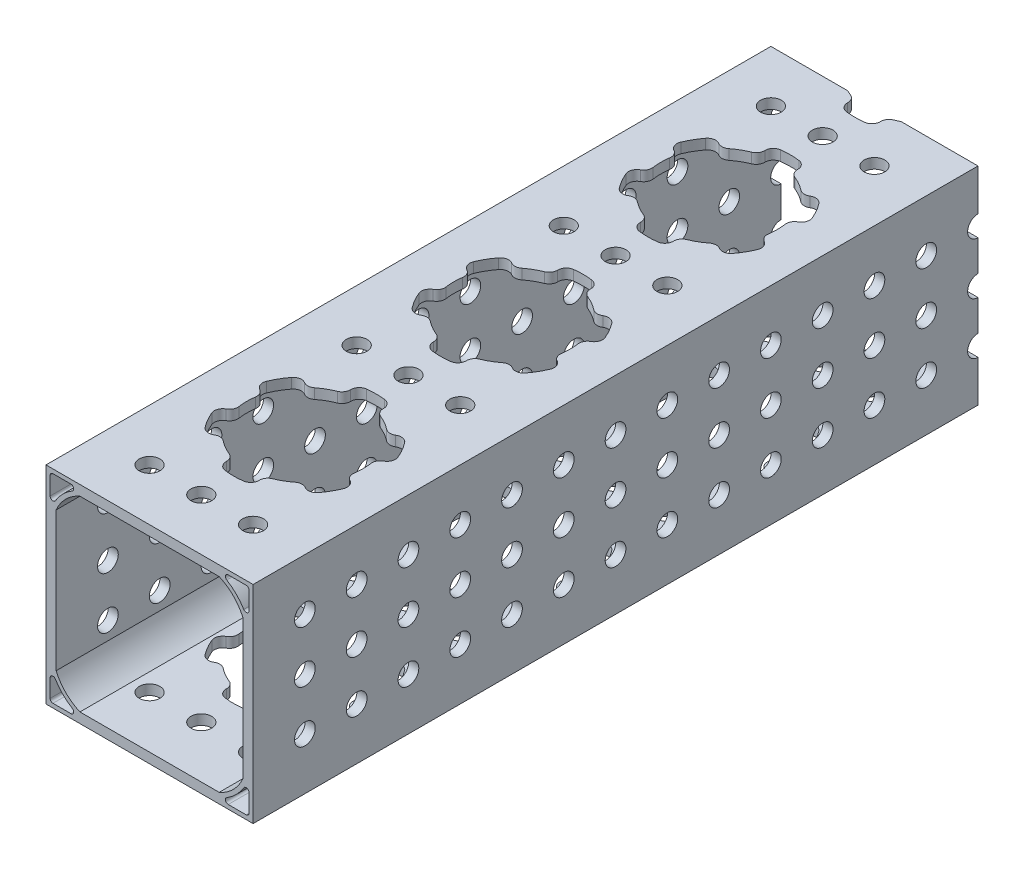
from build123d import *

# Parameters (mm, degrees)
SKETCH1_W                                = 50.8
SKETCH1_H                                = 50.8
BOSS_EXTRUDE1_DEPTH                      = 88.9
CUT_EXTRUDE1_DEPTH                       = 182.392282085
MIRROR1_AT_THE_SECOND_PLANE_COPY_1_DEPTH = 182.392282085
SKETCH3_R                                = 2.54
CUT_EXTRUDE2_DEPTH                       = 106.494123059
SKETCH4_R                                = 2.54
CUT_EXTRUDE3_DEPTH                       = 106.494123059


with BuildPart() as part:
    # Sketch1 → Boss-Extrude1 (new, symmetric)
    with BuildSketch(Plane.XY):
        Rectangle(SKETCH1_W, SKETCH1_H)
    extrude(amount=BOSS_EXTRUDE1_DEPTH, both=True)

    # Sketch2 → Cut-Extrude1 (cut, through all)
    with BuildSketch(Plane.XY.offset(88.9)):
        with BuildLine():
            Line((0, 0), (0, 22.914082254))
            Line((0, 22.914082254), (-17.077234966, 22.914082254))
            ThreePointArc((-17.077234966, 22.914082254), (-20.557724311, 20.557724311), (-22.914082254, 17.077234966))
            Line((-22.914082254, 17.077234966), (-22.914082254, 0))
            Line((-22.914082254, 0), (0, 0))
        make_face()
        with BuildLine():
            Line((-24.384, 23.692411086), (-24.384, 19.297089168))
            ThreePointArc((-24.384, 19.297089168), (-23.877056001, 18.630604749), (-23.099417578, 18.941204461))
            ThreePointArc((-23.099417578, 18.941204461), (-21.276144801, 21.276144801), (-18.941204461, 23.099417578))
            ThreePointArc((-18.941204461, 23.099417578), (-18.695249844, 23.351699105), (-18.605500254, 23.692411086))
            ThreePointArc((-18.605500254, 23.692411086), (-18.808061957, 24.181438297), (-19.297089168, 24.384))
            Line((-19.297089168, 24.384), (-23.692411086, 24.384))
            ThreePointArc((-23.692411086, 24.384), (-24.181438297, 24.181438297), (-24.384, 23.692411086))
        make_face()
    cut_extrude1 = extrude(amount=-CUT_EXTRUDE1_DEPTH, mode=Mode.SUBTRACT)

    # Mirror1: Cut-Extrude1 across plane
    add(cut_extrude1.mirror(Plane(origin=(0, 0, 0), x_dir=(0, 0, 1), z_dir=(1, 0, 0))), mode=Mode.SUBTRACT)

    # Mirror1 at the second plane: Cut-Extrude1 across plane
    add(cut_extrude1.mirror(Plane.ZX), mode=Mode.SUBTRACT)

    # Mirror1 at the second plane copy 1 sketc → Mirror1 at the second plane copy 1 (cut, through all)
    with BuildSketch(Plane(origin=(0, 0, 88.9), x_dir=(-1, 0, 0), z_dir=(0, 0, 1))):
        with BuildLine():
            Line((0, 0), (0, 22.914082254))
            Line((0, 22.914082254), (-17.077234966, 22.914082254))
            ThreePointArc((-17.077234966, 22.914082254), (-20.557724311, 20.557724311), (-22.914082254, 17.077234966))
            Line((-22.914082254, 17.077234966), (-22.914082254, 0))
            Line((-22.914082254, 0), (0, 0))
        make_face()
        with BuildLine():
            Line((-24.384, 23.692411086), (-24.384, 19.297089168))
            ThreePointArc((-24.384, 19.297089168), (-23.877056001, 18.630604749), (-23.099417578, 18.941204461))
            ThreePointArc((-23.099417578, 18.941204461), (-21.276144801, 21.276144801), (-18.941204461, 23.099417578))
            ThreePointArc((-18.941204461, 23.099417578), (-18.695249844, 23.351699105), (-18.605500254, 23.692411086))
            ThreePointArc((-18.605500254, 23.692411086), (-18.808061957, 24.181438297), (-19.297089168, 24.384))
            Line((-19.297089168, 24.384), (-23.692411086, 24.384))
            ThreePointArc((-23.692411086, 24.384), (-24.181438297, 24.181438297), (-24.384, 23.692411086))
        make_face()
    extrude(amount=-MIRROR1_AT_THE_SECOND_PLANE_COPY_1_DEPTH, mode=Mode.SUBTRACT)

    # Sketch3 → Cut-Extrude2 (cut, through all)
    with BuildSketch(Plane(origin=(0, 25.4, 0), x_dir=(1, 0, 0), z_dir=(0, 1, 0))):
        with Locations((-12.7, -76.2)):
            Circle(SKETCH3_R)
        with Locations((0, -76.2)):
            Circle(SKETCH3_R)
        with Locations((12.7, -76.2)):
            Circle(SKETCH3_R)
        with Locations((-12.7, -25.4)):
            Circle(SKETCH3_R)
        with Locations((0, -25.4)):
            Circle(SKETCH3_R)
        with Locations((12.7, -25.4)):
            Circle(SKETCH3_R)
        with Locations((-12.7, 25.4)):
            Circle(SKETCH3_R)
        with Locations((0, 25.4)):
            Circle(SKETCH3_R)
        with Locations((12.7, 25.4)):
            Circle(SKETCH3_R)
        with Locations((-12.7, 76.2)):
            Circle(SKETCH3_R)
        with Locations((0, 76.2)):
            Circle(SKETCH3_R)
        with Locations((12.7, 76.2)):
            Circle(SKETCH3_R)
        with Locations((-12.7, 127)):
            Circle(SKETCH3_R)
        with Locations((0, 127)):
            Circle(SKETCH3_R)
        with Locations((12.7, 127)):
            Circle(SKETCH3_R)
        with Locations((-12.7, 177.8)):
            Circle(SKETCH3_R)
        with Locations((0, 177.8)):
            Circle(SKETCH3_R)
        with Locations((12.7, 177.8)):
            Circle(SKETCH3_R)
        with Locations((-12.7, 228.6)):
            Circle(SKETCH3_R)
        with Locations((0, 228.6)):
            Circle(SKETCH3_R)
        with Locations((12.7, 228.6)):
            Circle(SKETCH3_R)
        with Locations((-12.7, 279.4)):
            Circle(SKETCH3_R)
        with Locations((0, 279.4)):
            Circle(SKETCH3_R)
        with Locations((12.7, 279.4)):
            Circle(SKETCH3_R)
        with Locations((-12.7, 330.2)):
            Circle(SKETCH3_R)
        with Locations((0, 330.2)):
            Circle(SKETCH3_R)
        with Locations((12.7, 330.2)):
            Circle(SKETCH3_R)
        with Locations((-12.7, 381)):
            Circle(SKETCH3_R)
        with Locations((0, 381)):
            Circle(SKETCH3_R)
        with Locations((12.7, 381)):
            Circle(SKETCH3_R)
        with Locations((-12.7, 431.8)):
            Circle(SKETCH3_R)
        with Locations((0, 431.8)):
            Circle(SKETCH3_R)
        with Locations((12.7, 431.8)):
            Circle(SKETCH3_R)
        with Locations((-12.7, 482.6)):
            Circle(SKETCH3_R)
        with Locations((0, 482.6)):
            Circle(SKETCH3_R)
        with Locations((12.7, 482.6)):
            Circle(SKETCH3_R)
        with Locations((-12.7, 533.4)):
            Circle(SKETCH3_R)
        with Locations((0, 533.4)):
            Circle(SKETCH3_R)
        with Locations((12.7, 533.4)):
            Circle(SKETCH3_R)
        with Locations((-12.7, 584.2)):
            Circle(SKETCH3_R)
        with Locations((0, 584.2)):
            Circle(SKETCH3_R)
        with Locations((12.7, 584.2)):
            Circle(SKETCH3_R)
        with Locations((-12.7, 635)):
            Circle(SKETCH3_R)
        with Locations((0, 635)):
            Circle(SKETCH3_R)
        with Locations((12.7, 635)):
            Circle(SKETCH3_R)
        with Locations((-12.7, 685.8)):
            Circle(SKETCH3_R)
        with Locations((0, 685.8)):
            Circle(SKETCH3_R)
        with Locations((12.7, 685.8)):
            Circle(SKETCH3_R)
        with Locations((-12.7, 736.6)):
            Circle(SKETCH3_R)
        with Locations((0, 736.6)):
            Circle(SKETCH3_R)
        with Locations((12.7, 736.6)):
            Circle(SKETCH3_R)
        with Locations((-12.7, 787.4)):
            Circle(SKETCH3_R)
        with Locations((0, 787.4)):
            Circle(SKETCH3_R)
        with Locations((12.7, 787.4)):
            Circle(SKETCH3_R)
        with Locations((-12.7, 838.2)):
            Circle(SKETCH3_R)
        with Locations((0, 838.2)):
            Circle(SKETCH3_R)
        with Locations((12.7, 838.2)):
            Circle(SKETCH3_R)
        with Locations((-12.7, 889)):
            Circle(SKETCH3_R)
        with Locations((0, 889)):
            Circle(SKETCH3_R)
        with Locations((12.7, 889)):
            Circle(SKETCH3_R)
        with Locations((-12.7, 939.8)):
            Circle(SKETCH3_R)
        with Locations((0, 939.8)):
            Circle(SKETCH3_R)
        with Locations((12.7, 939.8)):
            Circle(SKETCH3_R)
        with Locations((-12.7, 990.6)):
            Circle(SKETCH3_R)
        with Locations((0, 990.6)):
            Circle(SKETCH3_R)
        with Locations((12.7, 990.6)):
            Circle(SKETCH3_R)
        with Locations((-12.7, 1041.4)):
            Circle(SKETCH3_R)
        with Locations((0, 1041.4)):
            Circle(SKETCH3_R)
        with Locations((12.7, 1041.4)):
            Circle(SKETCH3_R)
        with Locations((-12.7, 1092.2)):
            Circle(SKETCH3_R)
        with Locations((0, 1092.2)):
            Circle(SKETCH3_R)
        with Locations((12.7, 1092.2)):
            Circle(SKETCH3_R)
        with BuildLine():
            ThreePointArc((-13.880514027, -40.204234968), (-15.122968614, -42.06875), (-16.116458703, -44.077004751))
            ThreePointArc((-16.116458703, -44.077004751), (-16.156831475, -45.550720378), (-15.197820243, -46.670436933))
            ThreePointArc((-15.197820243, -46.670436933), (-14.340320977, -47.552394043), (-14.142035584, -48.766410614))
            ThreePointArc((-14.142035584, -48.766410614), (-14.2875, -50.8), (-14.142035584, -52.833589386))
            ThreePointArc((-14.142035584, -52.833589386), (-14.340320977, -54.047605957), (-15.197820243, -54.929563067))
            ThreePointArc((-15.197820243, -54.929563067), (-16.156831475, -56.049279622), (-16.116458703, -57.522995249))
            ThreePointArc((-16.116458703, -57.522995249), (-15.122968614, -59.53125), (-13.880514027, -61.395765032))
            ThreePointArc((-13.880514027, -61.395765032), (-12.624425242, -62.167586691), (-11.175216644, -61.896916879))
            ThreePointArc((-11.175216644, -61.896916879), (-9.982669749, -61.595279286), (-8.832157861, -62.030567384))
            ThreePointArc((-8.832157861, -62.030567384), (-7.14375, -63.173337957), (-5.309877723, -64.06415677))
            ThreePointArc((-5.309877723, -64.06415677), (-4.357651228, -64.842885243), (-4.022603599, -66.026479946))
            ThreePointArc((-4.022603599, -66.026479946), (-3.532406233, -67.416866313), (-2.235944677, -68.11876028))
            ThreePointArc((-2.235944677, -68.11876028), (0, -68.2625), (2.235944677, -68.11876028))
            ThreePointArc((2.235944677, -68.11876028), (3.532406233, -67.416866313), (4.022603599, -66.026479946))
            ThreePointArc((4.022603599, -66.026479946), (4.357651228, -64.842885243), (5.309877723, -64.06415677))
            ThreePointArc((5.309877723, -64.06415677), (7.14375, -63.173337957), (8.832157861, -62.030567384))
            ThreePointArc((8.832157861, -62.030567384), (9.982669749, -61.595279286), (11.175216644, -61.896916879))
            ThreePointArc((11.175216644, -61.896916879), (12.624425242, -62.167586691), (13.880514027, -61.395765032))
            ThreePointArc((13.880514027, -61.395765032), (15.122968614, -59.53125), (16.116458703, -57.522995249))
            ThreePointArc((16.116458703, -57.522995249), (16.156831475, -56.049279622), (15.197820243, -54.929563067))
            ThreePointArc((15.197820243, -54.929563067), (14.340320977, -54.047605957), (14.142035584, -52.833589386))
            ThreePointArc((14.142035584, -52.833589386), (14.2875, -50.8), (14.142035584, -48.766410614))
            ThreePointArc((14.142035584, -48.766410614), (14.340320977, -47.552394043), (15.197820243, -46.670436933))
            ThreePointArc((15.197820243, -46.670436933), (16.156831475, -45.550720378), (16.116458703, -44.077004751))
            ThreePointArc((16.116458703, -44.077004751), (15.122968614, -42.06875), (13.880514027, -40.204234968))
            ThreePointArc((13.880514027, -40.204234968), (12.624425242, -39.432413309), (11.175216644, -39.703083121))
            ThreePointArc((11.175216644, -39.703083121), (9.982669749, -40.004720714), (8.832157861, -39.569432616))
            ThreePointArc((8.832157861, -39.569432616), (7.14375, -38.426662043), (5.309877723, -37.53584323))
            ThreePointArc((5.309877723, -37.53584323), (4.357651228, -36.757114757), (4.022603599, -35.573520054))
            ThreePointArc((4.022603599, -35.573520054), (3.532406233, -34.183133687), (2.235944677, -33.48123972))
            ThreePointArc((2.235944677, -33.48123972), (0, -33.3375), (-2.235944677, -33.48123972))
            ThreePointArc((-2.235944677, -33.48123972), (-3.532406233, -34.183133687), (-4.022603599, -35.573520054))
            ThreePointArc((-4.022603599, -35.573520054), (-4.357651228, -36.757114757), (-5.309877723, -37.53584323))
            ThreePointArc((-5.309877723, -37.53584323), (-7.14375, -38.426662043), (-8.832157861, -39.569432616))
            ThreePointArc((-8.832157861, -39.569432616), (-9.982669749, -40.004720714), (-11.175216644, -39.703083121))
            ThreePointArc((-11.175216644, -39.703083121), (-12.624425242, -39.432413309), (-13.880514027, -40.204234968))
        make_face()
        with BuildLine():
            ThreePointArc((-13.880514027, 10.595765032), (-15.122968614, 8.73125), (-16.116458703, 6.722995249))
            ThreePointArc((-16.116458703, 6.722995249), (-16.156831475, 5.249279622), (-15.197820243, 4.129563067))
            ThreePointArc((-15.197820243, 4.129563067), (-14.340320977, 3.247605957), (-14.142035584, 2.033589386))
            ThreePointArc((-14.142035584, 2.033589386), (-14.2875, 0), (-14.142035584, -2.033589386))
            ThreePointArc((-14.142035584, -2.033589386), (-14.340320977, -3.247605957), (-15.197820243, -4.129563067))
            ThreePointArc((-15.197820243, -4.129563067), (-16.156831475, -5.249279622), (-16.116458703, -6.722995249))
            ThreePointArc((-16.116458703, -6.722995249), (-15.122968614, -8.73125), (-13.880514027, -10.595765032))
            ThreePointArc((-13.880514027, -10.595765032), (-12.624425242, -11.367586691), (-11.175216644, -11.096916879))
            ThreePointArc((-11.175216644, -11.096916879), (-9.982669749, -10.795279286), (-8.832157861, -11.230567384))
            ThreePointArc((-8.832157861, -11.230567384), (-7.14375, -12.373337957), (-5.309877723, -13.26415677))
            ThreePointArc((-5.309877723, -13.26415677), (-4.357651228, -14.042885243), (-4.022603599, -15.226479946))
            ThreePointArc((-4.022603599, -15.226479946), (-3.532406233, -16.616866313), (-2.235944677, -17.31876028))
            ThreePointArc((-2.235944677, -17.31876028), (0, -17.4625), (2.235944677, -17.31876028))
            ThreePointArc((2.235944677, -17.31876028), (3.532406233, -16.616866313), (4.022603599, -15.226479946))
            ThreePointArc((4.022603599, -15.226479946), (4.357651228, -14.042885243), (5.309877723, -13.26415677))
            ThreePointArc((5.309877723, -13.26415677), (7.14375, -12.373337957), (8.832157861, -11.230567384))
            ThreePointArc((8.832157861, -11.230567384), (9.982669749, -10.795279286), (11.175216644, -11.096916879))
            ThreePointArc((11.175216644, -11.096916879), (12.624425242, -11.367586691), (13.880514027, -10.595765032))
            ThreePointArc((13.880514027, -10.595765032), (15.122968614, -8.73125), (16.116458703, -6.722995249))
            ThreePointArc((16.116458703, -6.722995249), (16.156831475, -5.249279622), (15.197820243, -4.129563067))
            ThreePointArc((15.197820243, -4.129563067), (14.340320977, -3.247605957), (14.142035584, -2.033589386))
            ThreePointArc((14.142035584, -2.033589386), (14.2875, 0), (14.142035584, 2.033589386))
            ThreePointArc((14.142035584, 2.033589386), (14.340320977, 3.247605957), (15.197820243, 4.129563067))
            ThreePointArc((15.197820243, 4.129563067), (16.156831475, 5.249279622), (16.116458703, 6.722995249))
            ThreePointArc((16.116458703, 6.722995249), (15.122968614, 8.73125), (13.880514027, 10.595765032))
            ThreePointArc((13.880514027, 10.595765032), (12.624425242, 11.367586691), (11.175216644, 11.096916879))
            ThreePointArc((11.175216644, 11.096916879), (9.982669749, 10.795279286), (8.832157861, 11.230567384))
            ThreePointArc((8.832157861, 11.230567384), (7.14375, 12.373337957), (5.309877723, 13.26415677))
            ThreePointArc((5.309877723, 13.26415677), (4.357651228, 14.042885243), (4.022603599, 15.226479946))
            ThreePointArc((4.022603599, 15.226479946), (3.532406233, 16.616866313), (2.235944677, 17.31876028))
            ThreePointArc((2.235944677, 17.31876028), (0, 17.4625), (-2.235944677, 17.31876028))
            ThreePointArc((-2.235944677, 17.31876028), (-3.532406233, 16.616866313), (-4.022603599, 15.226479946))
            ThreePointArc((-4.022603599, 15.226479946), (-4.357651228, 14.042885243), (-5.309877723, 13.26415677))
            ThreePointArc((-5.309877723, 13.26415677), (-7.14375, 12.373337957), (-8.832157861, 11.230567384))
            ThreePointArc((-8.832157861, 11.230567384), (-9.982669749, 10.795279286), (-11.175216644, 11.096916879))
            ThreePointArc((-11.175216644, 11.096916879), (-12.624425242, 11.367586691), (-13.880514027, 10.595765032))
        make_face()
        with BuildLine():
            ThreePointArc((-13.880514027, 61.395765032), (-15.122968614, 59.53125), (-16.116458703, 57.522995249))
            ThreePointArc((-16.116458703, 57.522995249), (-16.156831475, 56.049279622), (-15.197820243, 54.929563067))
            ThreePointArc((-15.197820243, 54.929563067), (-14.340320977, 54.047605957), (-14.142035584, 52.833589386))
            ThreePointArc((-14.142035584, 52.833589386), (-14.2875, 50.8), (-14.142035584, 48.766410614))
            ThreePointArc((-14.142035584, 48.766410614), (-14.340320977, 47.552394043), (-15.197820243, 46.670436933))
            ThreePointArc((-15.197820243, 46.670436933), (-16.156831475, 45.550720378), (-16.116458703, 44.077004751))
            ThreePointArc((-16.116458703, 44.077004751), (-15.122968614, 42.06875), (-13.880514027, 40.204234968))
            ThreePointArc((-13.880514027, 40.204234968), (-12.624425242, 39.432413309), (-11.175216644, 39.703083121))
            ThreePointArc((-11.175216644, 39.703083121), (-9.982669749, 40.004720714), (-8.832157861, 39.569432616))
            ThreePointArc((-8.832157861, 39.569432616), (-7.14375, 38.426662043), (-5.309877723, 37.53584323))
            ThreePointArc((-5.309877723, 37.53584323), (-4.357651228, 36.757114757), (-4.022603599, 35.573520054))
            ThreePointArc((-4.022603599, 35.573520054), (-3.532406233, 34.183133687), (-2.235944677, 33.48123972))
            ThreePointArc((-2.235944677, 33.48123972), (0, 33.3375), (2.235944677, 33.48123972))
            ThreePointArc((2.235944677, 33.48123972), (3.532406233, 34.183133687), (4.022603599, 35.573520054))
            ThreePointArc((4.022603599, 35.573520054), (4.357651228, 36.757114757), (5.309877723, 37.53584323))
            ThreePointArc((5.309877723, 37.53584323), (7.14375, 38.426662043), (8.832157861, 39.569432616))
            ThreePointArc((8.832157861, 39.569432616), (9.982669749, 40.004720714), (11.175216644, 39.703083121))
            ThreePointArc((11.175216644, 39.703083121), (12.624425242, 39.432413309), (13.880514027, 40.204234968))
            ThreePointArc((13.880514027, 40.204234968), (15.122968614, 42.06875), (16.116458703, 44.077004751))
            ThreePointArc((16.116458703, 44.077004751), (16.156831475, 45.550720378), (15.197820243, 46.670436933))
            ThreePointArc((15.197820243, 46.670436933), (14.340320977, 47.552394043), (14.142035584, 48.766410614))
            ThreePointArc((14.142035584, 48.766410614), (14.2875, 50.8), (14.142035584, 52.833589386))
            ThreePointArc((14.142035584, 52.833589386), (14.340320977, 54.047605957), (15.197820243, 54.929563067))
            ThreePointArc((15.197820243, 54.929563067), (16.156831475, 56.049279622), (16.116458703, 57.522995249))
            ThreePointArc((16.116458703, 57.522995249), (15.122968614, 59.53125), (13.880514027, 61.395765032))
            ThreePointArc((13.880514027, 61.395765032), (12.624425242, 62.167586691), (11.175216644, 61.896916879))
            ThreePointArc((11.175216644, 61.896916879), (9.982669749, 61.595279286), (8.832157861, 62.030567384))
            ThreePointArc((8.832157861, 62.030567384), (7.14375, 63.173337957), (5.309877723, 64.06415677))
            ThreePointArc((5.309877723, 64.06415677), (4.357651228, 64.842885243), (4.022603599, 66.026479946))
            ThreePointArc((4.022603599, 66.026479946), (3.532406233, 67.416866313), (2.235944677, 68.11876028))
            ThreePointArc((2.235944677, 68.11876028), (0, 68.2625), (-2.235944677, 68.11876028))
            ThreePointArc((-2.235944677, 68.11876028), (-3.532406233, 67.416866313), (-4.022603599, 66.026479946))
            ThreePointArc((-4.022603599, 66.026479946), (-4.357651228, 64.842885243), (-5.309877723, 64.06415677))
            ThreePointArc((-5.309877723, 64.06415677), (-7.14375, 63.173337957), (-8.832157861, 62.030567384))
            ThreePointArc((-8.832157861, 62.030567384), (-9.982669749, 61.595279286), (-11.175216644, 61.896916879))
            ThreePointArc((-11.175216644, 61.896916879), (-12.624425242, 62.167586691), (-13.880514027, 61.395765032))
        make_face()
        with BuildLine():
            ThreePointArc((-13.880514027, 112.195765032), (-15.122968614, 110.33125), (-16.116458703, 108.322995249))
            ThreePointArc((-16.116458703, 108.322995249), (-16.156831475, 106.849279622), (-15.197820243, 105.729563067))
            ThreePointArc((-15.197820243, 105.729563067), (-14.340320977, 104.847605957), (-14.142035584, 103.633589386))
            ThreePointArc((-14.142035584, 103.633589386), (-14.2875, 101.6), (-14.142035584, 99.566410614))
            ThreePointArc((-14.142035584, 99.566410614), (-14.340320977, 98.352394043), (-15.197820243, 97.470436933))
            ThreePointArc((-15.197820243, 97.470436933), (-16.156831475, 96.350720378), (-16.116458703, 94.877004751))
            ThreePointArc((-16.116458703, 94.877004751), (-15.122968614, 92.86875), (-13.880514027, 91.004234968))
            ThreePointArc((-13.880514027, 91.004234968), (-12.624425242, 90.232413309), (-11.175216644, 90.503083121))
            ThreePointArc((-11.175216644, 90.503083121), (-9.982669749, 90.804720714), (-8.832157861, 90.369432616))
            ThreePointArc((-8.832157861, 90.369432616), (-7.14375, 89.226662043), (-5.309877723, 88.33584323))
            ThreePointArc((-5.309877723, 88.33584323), (-4.357651228, 87.557114757), (-4.022603599, 86.373520054))
            ThreePointArc((-4.022603599, 86.373520054), (-3.532406233, 84.983133687), (-2.235944677, 84.28123972))
            ThreePointArc((-2.235944677, 84.28123972), (0, 84.1375), (2.235944677, 84.28123972))
            ThreePointArc((2.235944677, 84.28123972), (3.532406233, 84.983133687), (4.022603599, 86.373520054))
            ThreePointArc((4.022603599, 86.373520054), (4.357651228, 87.557114757), (5.309877723, 88.33584323))
            ThreePointArc((5.309877723, 88.33584323), (7.14375, 89.226662043), (8.832157861, 90.369432616))
            ThreePointArc((8.832157861, 90.369432616), (9.982669749, 90.804720714), (11.175216644, 90.503083121))
            ThreePointArc((11.175216644, 90.503083121), (12.624425242, 90.232413309), (13.880514027, 91.004234968))
            ThreePointArc((13.880514027, 91.004234968), (15.122968614, 92.86875), (16.116458703, 94.877004751))
            ThreePointArc((16.116458703, 94.877004751), (16.156831475, 96.350720378), (15.197820243, 97.470436933))
            ThreePointArc((15.197820243, 97.470436933), (14.340320977, 98.352394043), (14.142035584, 99.566410614))
            ThreePointArc((14.142035584, 99.566410614), (14.2875, 101.6), (14.142035584, 103.633589386))
            ThreePointArc((14.142035584, 103.633589386), (14.340320977, 104.847605957), (15.197820243, 105.729563067))
            ThreePointArc((15.197820243, 105.729563067), (16.156831475, 106.849279622), (16.116458703, 108.322995249))
            ThreePointArc((16.116458703, 108.322995249), (15.122968614, 110.33125), (13.880514027, 112.195765032))
            ThreePointArc((13.880514027, 112.195765032), (12.624425242, 112.967586691), (11.175216644, 112.696916879))
            ThreePointArc((11.175216644, 112.696916879), (9.982669749, 112.395279286), (8.832157861, 112.830567384))
            ThreePointArc((8.832157861, 112.830567384), (7.14375, 113.973337957), (5.309877723, 114.86415677))
            ThreePointArc((5.309877723, 114.86415677), (4.357651228, 115.642885243), (4.022603599, 116.826479946))
            ThreePointArc((4.022603599, 116.826479946), (3.532406233, 118.216866313), (2.235944677, 118.91876028))
            ThreePointArc((2.235944677, 118.91876028), (0, 119.0625), (-2.235944677, 118.91876028))
            ThreePointArc((-2.235944677, 118.91876028), (-3.532406233, 118.216866313), (-4.022603599, 116.826479946))
            ThreePointArc((-4.022603599, 116.826479946), (-4.357651228, 115.642885243), (-5.309877723, 114.86415677))
            ThreePointArc((-5.309877723, 114.86415677), (-7.14375, 113.973337957), (-8.832157861, 112.830567384))
            ThreePointArc((-8.832157861, 112.830567384), (-9.982669749, 112.395279286), (-11.175216644, 112.696916879))
            ThreePointArc((-11.175216644, 112.696916879), (-12.624425242, 112.967586691), (-13.880514027, 112.195765032))
        make_face()
        with BuildLine():
            ThreePointArc((-13.880514027, 162.995765032), (-15.122968614, 161.13125), (-16.116458703, 159.122995249))
            ThreePointArc((-16.116458703, 159.122995249), (-16.156831475, 157.649279622), (-15.197820243, 156.529563067))
            ThreePointArc((-15.197820243, 156.529563067), (-14.340320977, 155.647605957), (-14.142035584, 154.433589386))
            ThreePointArc((-14.142035584, 154.433589386), (-14.2875, 152.4), (-14.142035584, 150.366410614))
            ThreePointArc((-14.142035584, 150.366410614), (-14.340320977, 149.152394043), (-15.197820243, 148.270436933))
            ThreePointArc((-15.197820243, 148.270436933), (-16.156831475, 147.150720378), (-16.116458703, 145.677004751))
            ThreePointArc((-16.116458703, 145.677004751), (-15.122968614, 143.66875), (-13.880514027, 141.804234968))
            ThreePointArc((-13.880514027, 141.804234968), (-12.624425242, 141.032413309), (-11.175216644, 141.303083121))
            ThreePointArc((-11.175216644, 141.303083121), (-9.982669749, 141.604720714), (-8.832157861, 141.169432616))
            ThreePointArc((-8.832157861, 141.169432616), (-7.14375, 140.026662043), (-5.309877723, 139.13584323))
            ThreePointArc((-5.309877723, 139.13584323), (-4.357651228, 138.357114757), (-4.022603599, 137.173520054))
            ThreePointArc((-4.022603599, 137.173520054), (-3.532406233, 135.783133687), (-2.235944677, 135.08123972))
            ThreePointArc((-2.235944677, 135.08123972), (0, 134.9375), (2.235944677, 135.08123972))
            ThreePointArc((2.235944677, 135.08123972), (3.532406233, 135.783133687), (4.022603599, 137.173520054))
            ThreePointArc((4.022603599, 137.173520054), (4.357651228, 138.357114757), (5.309877723, 139.13584323))
            ThreePointArc((5.309877723, 139.13584323), (7.14375, 140.026662043), (8.832157861, 141.169432616))
            ThreePointArc((8.832157861, 141.169432616), (9.982669749, 141.604720714), (11.175216644, 141.303083121))
            ThreePointArc((11.175216644, 141.303083121), (12.624425242, 141.032413309), (13.880514027, 141.804234968))
            ThreePointArc((13.880514027, 141.804234968), (15.122968614, 143.66875), (16.116458703, 145.677004751))
            ThreePointArc((16.116458703, 145.677004751), (16.156831475, 147.150720378), (15.197820243, 148.270436933))
            ThreePointArc((15.197820243, 148.270436933), (14.340320977, 149.152394043), (14.142035584, 150.366410614))
            ThreePointArc((14.142035584, 150.366410614), (14.2875, 152.4), (14.142035584, 154.433589386))
            ThreePointArc((14.142035584, 154.433589386), (14.340320977, 155.647605957), (15.197820243, 156.529563067))
            ThreePointArc((15.197820243, 156.529563067), (16.156831475, 157.649279622), (16.116458703, 159.122995249))
            ThreePointArc((16.116458703, 159.122995249), (15.122968614, 161.13125), (13.880514027, 162.995765032))
            ThreePointArc((13.880514027, 162.995765032), (12.624425242, 163.767586691), (11.175216644, 163.496916879))
            ThreePointArc((11.175216644, 163.496916879), (9.982669749, 163.195279286), (8.832157861, 163.630567384))
            ThreePointArc((8.832157861, 163.630567384), (7.14375, 164.773337957), (5.309877723, 165.66415677))
            ThreePointArc((5.309877723, 165.66415677), (4.357651228, 166.442885243), (4.022603599, 167.626479946))
            ThreePointArc((4.022603599, 167.626479946), (3.532406233, 169.016866313), (2.235944677, 169.71876028))
            ThreePointArc((2.235944677, 169.71876028), (0, 169.8625), (-2.235944677, 169.71876028))
            ThreePointArc((-2.235944677, 169.71876028), (-3.532406233, 169.016866313), (-4.022603599, 167.626479946))
            ThreePointArc((-4.022603599, 167.626479946), (-4.357651228, 166.442885243), (-5.309877723, 165.66415677))
            ThreePointArc((-5.309877723, 165.66415677), (-7.14375, 164.773337957), (-8.832157861, 163.630567384))
            ThreePointArc((-8.832157861, 163.630567384), (-9.982669749, 163.195279286), (-11.175216644, 163.496916879))
            ThreePointArc((-11.175216644, 163.496916879), (-12.624425242, 163.767586691), (-13.880514027, 162.995765032))
        make_face()
        with BuildLine():
            ThreePointArc((-13.880514027, 213.795765032), (-15.122968614, 211.93125), (-16.116458703, 209.922995249))
            ThreePointArc((-16.116458703, 209.922995249), (-16.156831475, 208.449279622), (-15.197820243, 207.329563067))
            ThreePointArc((-15.197820243, 207.329563067), (-14.340320977, 206.447605957), (-14.142035584, 205.233589386))
            ThreePointArc((-14.142035584, 205.233589386), (-14.2875, 203.2), (-14.142035584, 201.166410614))
            ThreePointArc((-14.142035584, 201.166410614), (-14.340320977, 199.952394043), (-15.197820243, 199.070436933))
            ThreePointArc((-15.197820243, 199.070436933), (-16.156831475, 197.950720378), (-16.116458703, 196.477004751))
            ThreePointArc((-16.116458703, 196.477004751), (-15.122968614, 194.46875), (-13.880514027, 192.604234968))
            ThreePointArc((-13.880514027, 192.604234968), (-12.624425242, 191.832413309), (-11.175216644, 192.103083121))
            ThreePointArc((-11.175216644, 192.103083121), (-9.982669749, 192.404720714), (-8.832157861, 191.969432616))
            ThreePointArc((-8.832157861, 191.969432616), (-7.14375, 190.826662043), (-5.309877723, 189.93584323))
            ThreePointArc((-5.309877723, 189.93584323), (-4.357651228, 189.157114757), (-4.022603599, 187.973520054))
            ThreePointArc((-4.022603599, 187.973520054), (-3.532406233, 186.583133687), (-2.235944677, 185.88123972))
            ThreePointArc((-2.235944677, 185.88123972), (0, 185.7375), (2.235944677, 185.88123972))
            ThreePointArc((2.235944677, 185.88123972), (3.532406233, 186.583133687), (4.022603599, 187.973520054))
            ThreePointArc((4.022603599, 187.973520054), (4.357651228, 189.157114757), (5.309877723, 189.93584323))
            ThreePointArc((5.309877723, 189.93584323), (7.14375, 190.826662043), (8.832157861, 191.969432616))
            ThreePointArc((8.832157861, 191.969432616), (9.982669749, 192.404720714), (11.175216644, 192.103083121))
            ThreePointArc((11.175216644, 192.103083121), (12.624425242, 191.832413309), (13.880514027, 192.604234968))
            ThreePointArc((13.880514027, 192.604234968), (15.122968614, 194.46875), (16.116458703, 196.477004751))
            ThreePointArc((16.116458703, 196.477004751), (16.156831475, 197.950720378), (15.197820243, 199.070436933))
            ThreePointArc((15.197820243, 199.070436933), (14.340320977, 199.952394043), (14.142035584, 201.166410614))
            ThreePointArc((14.142035584, 201.166410614), (14.2875, 203.2), (14.142035584, 205.233589386))
            ThreePointArc((14.142035584, 205.233589386), (14.340320977, 206.447605957), (15.197820243, 207.329563067))
            ThreePointArc((15.197820243, 207.329563067), (16.156831475, 208.449279622), (16.116458703, 209.922995249))
            ThreePointArc((16.116458703, 209.922995249), (15.122968614, 211.93125), (13.880514027, 213.795765032))
            ThreePointArc((13.880514027, 213.795765032), (12.624425242, 214.567586691), (11.175216644, 214.296916879))
            ThreePointArc((11.175216644, 214.296916879), (9.982669749, 213.995279286), (8.832157861, 214.430567384))
            ThreePointArc((8.832157861, 214.430567384), (7.14375, 215.573337957), (5.309877723, 216.46415677))
            ThreePointArc((5.309877723, 216.46415677), (4.357651228, 217.242885243), (4.022603599, 218.426479946))
            ThreePointArc((4.022603599, 218.426479946), (3.532406233, 219.816866313), (2.235944677, 220.51876028))
            ThreePointArc((2.235944677, 220.51876028), (0, 220.6625), (-2.235944677, 220.51876028))
            ThreePointArc((-2.235944677, 220.51876028), (-3.532406233, 219.816866313), (-4.022603599, 218.426479946))
            ThreePointArc((-4.022603599, 218.426479946), (-4.357651228, 217.242885243), (-5.309877723, 216.46415677))
            ThreePointArc((-5.309877723, 216.46415677), (-7.14375, 215.573337957), (-8.832157861, 214.430567384))
            ThreePointArc((-8.832157861, 214.430567384), (-9.982669749, 213.995279286), (-11.175216644, 214.296916879))
            ThreePointArc((-11.175216644, 214.296916879), (-12.624425242, 214.567586691), (-13.880514027, 213.795765032))
        make_face()
        with BuildLine():
            ThreePointArc((-13.880514027, 264.595765032), (-15.122968614, 262.73125), (-16.116458703, 260.722995249))
            ThreePointArc((-16.116458703, 260.722995249), (-16.156831475, 259.249279622), (-15.197820243, 258.129563067))
            ThreePointArc((-15.197820243, 258.129563067), (-14.340320977, 257.247605957), (-14.142035584, 256.033589386))
            ThreePointArc((-14.142035584, 256.033589386), (-14.2875, 254), (-14.142035584, 251.966410614))
            ThreePointArc((-14.142035584, 251.966410614), (-14.340320977, 250.752394043), (-15.197820243, 249.870436933))
            ThreePointArc((-15.197820243, 249.870436933), (-16.156831475, 248.750720378), (-16.116458703, 247.277004751))
            ThreePointArc((-16.116458703, 247.277004751), (-15.122968614, 245.26875), (-13.880514027, 243.404234968))
            ThreePointArc((-13.880514027, 243.404234968), (-12.624425242, 242.632413309), (-11.175216644, 242.903083121))
            ThreePointArc((-11.175216644, 242.903083121), (-9.982669749, 243.204720714), (-8.832157861, 242.769432616))
            ThreePointArc((-8.832157861, 242.769432616), (-7.14375, 241.626662043), (-5.309877723, 240.73584323))
            ThreePointArc((-5.309877723, 240.73584323), (-4.357651228, 239.957114757), (-4.022603599, 238.773520054))
            ThreePointArc((-4.022603599, 238.773520054), (-3.532406233, 237.383133687), (-2.235944677, 236.68123972))
            ThreePointArc((-2.235944677, 236.68123972), (0, 236.5375), (2.235944677, 236.68123972))
            ThreePointArc((2.235944677, 236.68123972), (3.532406233, 237.383133687), (4.022603599, 238.773520054))
            ThreePointArc((4.022603599, 238.773520054), (4.357651228, 239.957114757), (5.309877723, 240.73584323))
            ThreePointArc((5.309877723, 240.73584323), (7.14375, 241.626662043), (8.832157861, 242.769432616))
            ThreePointArc((8.832157861, 242.769432616), (9.982669749, 243.204720714), (11.175216644, 242.903083121))
            ThreePointArc((11.175216644, 242.903083121), (12.624425242, 242.632413309), (13.880514027, 243.404234968))
            ThreePointArc((13.880514027, 243.404234968), (15.122968614, 245.26875), (16.116458703, 247.277004751))
            ThreePointArc((16.116458703, 247.277004751), (16.156831475, 248.750720378), (15.197820243, 249.870436933))
            ThreePointArc((15.197820243, 249.870436933), (14.340320977, 250.752394043), (14.142035584, 251.966410614))
            ThreePointArc((14.142035584, 251.966410614), (14.2875, 254), (14.142035584, 256.033589386))
            ThreePointArc((14.142035584, 256.033589386), (14.340320977, 257.247605957), (15.197820243, 258.129563067))
            ThreePointArc((15.197820243, 258.129563067), (16.156831475, 259.249279622), (16.116458703, 260.722995249))
            ThreePointArc((16.116458703, 260.722995249), (15.122968614, 262.73125), (13.880514027, 264.595765032))
            ThreePointArc((13.880514027, 264.595765032), (12.624425242, 265.367586691), (11.175216644, 265.096916879))
            ThreePointArc((11.175216644, 265.096916879), (9.982669749, 264.795279286), (8.832157861, 265.230567384))
            ThreePointArc((8.832157861, 265.230567384), (7.14375, 266.373337957), (5.309877723, 267.26415677))
            ThreePointArc((5.309877723, 267.26415677), (4.357651228, 268.042885243), (4.022603599, 269.226479946))
            ThreePointArc((4.022603599, 269.226479946), (3.532406233, 270.616866313), (2.235944677, 271.31876028))
            ThreePointArc((2.235944677, 271.31876028), (0, 271.4625), (-2.235944677, 271.31876028))
            ThreePointArc((-2.235944677, 271.31876028), (-3.532406233, 270.616866313), (-4.022603599, 269.226479946))
            ThreePointArc((-4.022603599, 269.226479946), (-4.357651228, 268.042885243), (-5.309877723, 267.26415677))
            ThreePointArc((-5.309877723, 267.26415677), (-7.14375, 266.373337957), (-8.832157861, 265.230567384))
            ThreePointArc((-8.832157861, 265.230567384), (-9.982669749, 264.795279286), (-11.175216644, 265.096916879))
            ThreePointArc((-11.175216644, 265.096916879), (-12.624425242, 265.367586691), (-13.880514027, 264.595765032))
        make_face()
        with BuildLine():
            ThreePointArc((-13.880514027, 315.395765032), (-15.122968614, 313.53125), (-16.116458703, 311.522995249))
            ThreePointArc((-16.116458703, 311.522995249), (-16.156831475, 310.049279622), (-15.197820243, 308.929563067))
            ThreePointArc((-15.197820243, 308.929563067), (-14.340320977, 308.047605957), (-14.142035584, 306.833589386))
            ThreePointArc((-14.142035584, 306.833589386), (-14.2875, 304.8), (-14.142035584, 302.766410614))
            ThreePointArc((-14.142035584, 302.766410614), (-14.340320977, 301.552394043), (-15.197820243, 300.670436933))
            ThreePointArc((-15.197820243, 300.670436933), (-16.156831475, 299.550720378), (-16.116458703, 298.077004751))
            ThreePointArc((-16.116458703, 298.077004751), (-15.122968614, 296.06875), (-13.880514027, 294.204234968))
            ThreePointArc((-13.880514027, 294.204234968), (-12.624425242, 293.432413309), (-11.175216644, 293.703083121))
            ThreePointArc((-11.175216644, 293.703083121), (-9.982669749, 294.004720714), (-8.832157861, 293.569432616))
            ThreePointArc((-8.832157861, 293.569432616), (-7.14375, 292.426662043), (-5.309877723, 291.53584323))
            ThreePointArc((-5.309877723, 291.53584323), (-4.357651228, 290.757114757), (-4.022603599, 289.573520054))
            ThreePointArc((-4.022603599, 289.573520054), (-3.532406233, 288.183133687), (-2.235944677, 287.48123972))
            ThreePointArc((-2.235944677, 287.48123972), (0, 287.3375), (2.235944677, 287.48123972))
            ThreePointArc((2.235944677, 287.48123972), (3.532406233, 288.183133687), (4.022603599, 289.573520054))
            ThreePointArc((4.022603599, 289.573520054), (4.357651228, 290.757114757), (5.309877723, 291.53584323))
            ThreePointArc((5.309877723, 291.53584323), (7.14375, 292.426662043), (8.832157861, 293.569432616))
            ThreePointArc((8.832157861, 293.569432616), (9.982669749, 294.004720714), (11.175216644, 293.703083121))
            ThreePointArc((11.175216644, 293.703083121), (12.624425242, 293.432413309), (13.880514027, 294.204234968))
            ThreePointArc((13.880514027, 294.204234968), (15.122968614, 296.06875), (16.116458703, 298.077004751))
            ThreePointArc((16.116458703, 298.077004751), (16.156831475, 299.550720378), (15.197820243, 300.670436933))
            ThreePointArc((15.197820243, 300.670436933), (14.340320977, 301.552394043), (14.142035584, 302.766410614))
            ThreePointArc((14.142035584, 302.766410614), (14.2875, 304.8), (14.142035584, 306.833589386))
            ThreePointArc((14.142035584, 306.833589386), (14.340320977, 308.047605957), (15.197820243, 308.929563067))
            ThreePointArc((15.197820243, 308.929563067), (16.156831475, 310.049279622), (16.116458703, 311.522995249))
            ThreePointArc((16.116458703, 311.522995249), (15.122968614, 313.53125), (13.880514027, 315.395765032))
            ThreePointArc((13.880514027, 315.395765032), (12.624425242, 316.167586691), (11.175216644, 315.896916879))
            ThreePointArc((11.175216644, 315.896916879), (9.982669749, 315.595279286), (8.832157861, 316.030567384))
            ThreePointArc((8.832157861, 316.030567384), (7.14375, 317.173337957), (5.309877723, 318.06415677))
            ThreePointArc((5.309877723, 318.06415677), (4.357651228, 318.842885243), (4.022603599, 320.026479946))
            ThreePointArc((4.022603599, 320.026479946), (3.532406233, 321.416866313), (2.235944677, 322.11876028))
            ThreePointArc((2.235944677, 322.11876028), (0, 322.2625), (-2.235944677, 322.11876028))
            ThreePointArc((-2.235944677, 322.11876028), (-3.532406233, 321.416866313), (-4.022603599, 320.026479946))
            ThreePointArc((-4.022603599, 320.026479946), (-4.357651228, 318.842885243), (-5.309877723, 318.06415677))
            ThreePointArc((-5.309877723, 318.06415677), (-7.14375, 317.173337957), (-8.832157861, 316.030567384))
            ThreePointArc((-8.832157861, 316.030567384), (-9.982669749, 315.595279286), (-11.175216644, 315.896916879))
            ThreePointArc((-11.175216644, 315.896916879), (-12.624425242, 316.167586691), (-13.880514027, 315.395765032))
        make_face()
        with BuildLine():
            ThreePointArc((-13.880514027, 366.195765032), (-15.122968614, 364.33125), (-16.116458703, 362.322995249))
            ThreePointArc((-16.116458703, 362.322995249), (-16.156831475, 360.849279622), (-15.197820243, 359.729563067))
            ThreePointArc((-15.197820243, 359.729563067), (-14.340320977, 358.847605957), (-14.142035584, 357.633589386))
            ThreePointArc((-14.142035584, 357.633589386), (-14.2875, 355.6), (-14.142035584, 353.566410614))
            ThreePointArc((-14.142035584, 353.566410614), (-14.340320977, 352.352394043), (-15.197820243, 351.470436933))
            ThreePointArc((-15.197820243, 351.470436933), (-16.156831475, 350.350720378), (-16.116458703, 348.877004751))
            ThreePointArc((-16.116458703, 348.877004751), (-15.122968614, 346.86875), (-13.880514027, 345.004234968))
            ThreePointArc((-13.880514027, 345.004234968), (-12.624425242, 344.232413309), (-11.175216644, 344.503083121))
            ThreePointArc((-11.175216644, 344.503083121), (-9.982669749, 344.804720714), (-8.832157861, 344.369432616))
            ThreePointArc((-8.832157861, 344.369432616), (-7.14375, 343.226662043), (-5.309877723, 342.33584323))
            ThreePointArc((-5.309877723, 342.33584323), (-4.357651228, 341.557114757), (-4.022603599, 340.373520054))
            ThreePointArc((-4.022603599, 340.373520054), (-3.532406233, 338.983133687), (-2.235944677, 338.28123972))
            ThreePointArc((-2.235944677, 338.28123972), (0, 338.1375), (2.235944677, 338.28123972))
            ThreePointArc((2.235944677, 338.28123972), (3.532406233, 338.983133687), (4.022603599, 340.373520054))
            ThreePointArc((4.022603599, 340.373520054), (4.357651228, 341.557114757), (5.309877723, 342.33584323))
            ThreePointArc((5.309877723, 342.33584323), (7.14375, 343.226662043), (8.832157861, 344.369432616))
            ThreePointArc((8.832157861, 344.369432616), (9.982669749, 344.804720714), (11.175216644, 344.503083121))
            ThreePointArc((11.175216644, 344.503083121), (12.624425242, 344.232413309), (13.880514027, 345.004234968))
            ThreePointArc((13.880514027, 345.004234968), (15.122968614, 346.86875), (16.116458703, 348.877004751))
            ThreePointArc((16.116458703, 348.877004751), (16.156831475, 350.350720378), (15.197820243, 351.470436933))
            ThreePointArc((15.197820243, 351.470436933), (14.340320977, 352.352394043), (14.142035584, 353.566410614))
            ThreePointArc((14.142035584, 353.566410614), (14.2875, 355.6), (14.142035584, 357.633589386))
            ThreePointArc((14.142035584, 357.633589386), (14.340320977, 358.847605957), (15.197820243, 359.729563067))
            ThreePointArc((15.197820243, 359.729563067), (16.156831475, 360.849279622), (16.116458703, 362.322995249))
            ThreePointArc((16.116458703, 362.322995249), (15.122968614, 364.33125), (13.880514027, 366.195765032))
            ThreePointArc((13.880514027, 366.195765032), (12.624425242, 366.967586691), (11.175216644, 366.696916879))
            ThreePointArc((11.175216644, 366.696916879), (9.982669749, 366.395279286), (8.832157861, 366.830567384))
            ThreePointArc((8.832157861, 366.830567384), (7.14375, 367.973337957), (5.309877723, 368.86415677))
            ThreePointArc((5.309877723, 368.86415677), (4.357651228, 369.642885243), (4.022603599, 370.826479946))
            ThreePointArc((4.022603599, 370.826479946), (3.532406233, 372.216866313), (2.235944677, 372.91876028))
            ThreePointArc((2.235944677, 372.91876028), (0, 373.0625), (-2.235944677, 372.91876028))
            ThreePointArc((-2.235944677, 372.91876028), (-3.532406233, 372.216866313), (-4.022603599, 370.826479946))
            ThreePointArc((-4.022603599, 370.826479946), (-4.357651228, 369.642885243), (-5.309877723, 368.86415677))
            ThreePointArc((-5.309877723, 368.86415677), (-7.14375, 367.973337957), (-8.832157861, 366.830567384))
            ThreePointArc((-8.832157861, 366.830567384), (-9.982669749, 366.395279286), (-11.175216644, 366.696916879))
            ThreePointArc((-11.175216644, 366.696916879), (-12.624425242, 366.967586691), (-13.880514027, 366.195765032))
        make_face()
        with BuildLine():
            ThreePointArc((-13.880514027, 416.995765032), (-15.122968614, 415.13125), (-16.116458703, 413.122995249))
            ThreePointArc((-16.116458703, 413.122995249), (-16.156831475, 411.649279622), (-15.197820243, 410.529563067))
            ThreePointArc((-15.197820243, 410.529563067), (-14.340320977, 409.647605957), (-14.142035584, 408.433589386))
            ThreePointArc((-14.142035584, 408.433589386), (-14.2875, 406.4), (-14.142035584, 404.366410614))
            ThreePointArc((-14.142035584, 404.366410614), (-14.340320977, 403.152394043), (-15.197820243, 402.270436933))
            ThreePointArc((-15.197820243, 402.270436933), (-16.156831475, 401.150720378), (-16.116458703, 399.677004751))
            ThreePointArc((-16.116458703, 399.677004751), (-15.122968614, 397.66875), (-13.880514027, 395.804234968))
            ThreePointArc((-13.880514027, 395.804234968), (-12.624425242, 395.032413309), (-11.175216644, 395.303083121))
            ThreePointArc((-11.175216644, 395.303083121), (-9.982669749, 395.604720714), (-8.832157861, 395.169432616))
            ThreePointArc((-8.832157861, 395.169432616), (-7.14375, 394.026662043), (-5.309877723, 393.13584323))
            ThreePointArc((-5.309877723, 393.13584323), (-4.357651228, 392.357114757), (-4.022603599, 391.173520054))
            ThreePointArc((-4.022603599, 391.173520054), (-3.532406233, 389.783133687), (-2.235944677, 389.08123972))
            ThreePointArc((-2.235944677, 389.08123972), (0, 388.9375), (2.235944677, 389.08123972))
            ThreePointArc((2.235944677, 389.08123972), (3.532406233, 389.783133687), (4.022603599, 391.173520054))
            ThreePointArc((4.022603599, 391.173520054), (4.357651228, 392.357114757), (5.309877723, 393.13584323))
            ThreePointArc((5.309877723, 393.13584323), (7.14375, 394.026662043), (8.832157861, 395.169432616))
            ThreePointArc((8.832157861, 395.169432616), (9.982669749, 395.604720714), (11.175216644, 395.303083121))
            ThreePointArc((11.175216644, 395.303083121), (12.624425242, 395.032413309), (13.880514027, 395.804234968))
            ThreePointArc((13.880514027, 395.804234968), (15.122968614, 397.66875), (16.116458703, 399.677004751))
            ThreePointArc((16.116458703, 399.677004751), (16.156831475, 401.150720378), (15.197820243, 402.270436933))
            ThreePointArc((15.197820243, 402.270436933), (14.340320977, 403.152394043), (14.142035584, 404.366410614))
            ThreePointArc((14.142035584, 404.366410614), (14.2875, 406.4), (14.142035584, 408.433589386))
            ThreePointArc((14.142035584, 408.433589386), (14.340320977, 409.647605957), (15.197820243, 410.529563067))
            ThreePointArc((15.197820243, 410.529563067), (16.156831475, 411.649279622), (16.116458703, 413.122995249))
            ThreePointArc((16.116458703, 413.122995249), (15.122968614, 415.13125), (13.880514027, 416.995765032))
            ThreePointArc((13.880514027, 416.995765032), (12.624425242, 417.767586691), (11.175216644, 417.496916879))
            ThreePointArc((11.175216644, 417.496916879), (9.982669749, 417.195279286), (8.832157861, 417.630567384))
            ThreePointArc((8.832157861, 417.630567384), (7.14375, 418.773337957), (5.309877723, 419.66415677))
            ThreePointArc((5.309877723, 419.66415677), (4.357651228, 420.442885243), (4.022603599, 421.626479946))
            ThreePointArc((4.022603599, 421.626479946), (3.532406233, 423.016866313), (2.235944677, 423.71876028))
            ThreePointArc((2.235944677, 423.71876028), (0, 423.8625), (-2.235944677, 423.71876028))
            ThreePointArc((-2.235944677, 423.71876028), (-3.532406233, 423.016866313), (-4.022603599, 421.626479946))
            ThreePointArc((-4.022603599, 421.626479946), (-4.357651228, 420.442885243), (-5.309877723, 419.66415677))
            ThreePointArc((-5.309877723, 419.66415677), (-7.14375, 418.773337957), (-8.832157861, 417.630567384))
            ThreePointArc((-8.832157861, 417.630567384), (-9.982669749, 417.195279286), (-11.175216644, 417.496916879))
            ThreePointArc((-11.175216644, 417.496916879), (-12.624425242, 417.767586691), (-13.880514027, 416.995765032))
        make_face()
        with BuildLine():
            ThreePointArc((-13.880514027, 467.795765032), (-15.122968614, 465.93125), (-16.116458703, 463.922995249))
            ThreePointArc((-16.116458703, 463.922995249), (-16.156831475, 462.449279622), (-15.197820243, 461.329563067))
            ThreePointArc((-15.197820243, 461.329563067), (-14.340320977, 460.447605957), (-14.142035584, 459.233589386))
            ThreePointArc((-14.142035584, 459.233589386), (-14.2875, 457.2), (-14.142035584, 455.166410614))
            ThreePointArc((-14.142035584, 455.166410614), (-14.340320977, 453.952394043), (-15.197820243, 453.070436933))
            ThreePointArc((-15.197820243, 453.070436933), (-16.156831475, 451.950720378), (-16.116458703, 450.477004751))
            ThreePointArc((-16.116458703, 450.477004751), (-15.122968614, 448.46875), (-13.880514027, 446.604234968))
            ThreePointArc((-13.880514027, 446.604234968), (-12.624425242, 445.832413309), (-11.175216644, 446.103083121))
            ThreePointArc((-11.175216644, 446.103083121), (-9.982669749, 446.404720714), (-8.832157861, 445.969432616))
            ThreePointArc((-8.832157861, 445.969432616), (-7.14375, 444.826662043), (-5.309877723, 443.93584323))
            ThreePointArc((-5.309877723, 443.93584323), (-4.357651228, 443.157114757), (-4.022603599, 441.973520054))
            ThreePointArc((-4.022603599, 441.973520054), (-3.532406233, 440.583133687), (-2.235944677, 439.88123972))
            ThreePointArc((-2.235944677, 439.88123972), (0, 439.7375), (2.235944677, 439.88123972))
            ThreePointArc((2.235944677, 439.88123972), (3.532406233, 440.583133687), (4.022603599, 441.973520054))
            ThreePointArc((4.022603599, 441.973520054), (4.357651228, 443.157114757), (5.309877723, 443.93584323))
            ThreePointArc((5.309877723, 443.93584323), (7.14375, 444.826662043), (8.832157861, 445.969432616))
            ThreePointArc((8.832157861, 445.969432616), (9.982669749, 446.404720714), (11.175216644, 446.103083121))
            ThreePointArc((11.175216644, 446.103083121), (12.624425242, 445.832413309), (13.880514027, 446.604234968))
            ThreePointArc((13.880514027, 446.604234968), (15.122968614, 448.46875), (16.116458703, 450.477004751))
            ThreePointArc((16.116458703, 450.477004751), (16.156831475, 451.950720378), (15.197820243, 453.070436933))
            ThreePointArc((15.197820243, 453.070436933), (14.340320977, 453.952394043), (14.142035584, 455.166410614))
            ThreePointArc((14.142035584, 455.166410614), (14.2875, 457.2), (14.142035584, 459.233589386))
            ThreePointArc((14.142035584, 459.233589386), (14.340320977, 460.447605957), (15.197820243, 461.329563067))
            ThreePointArc((15.197820243, 461.329563067), (16.156831475, 462.449279622), (16.116458703, 463.922995249))
            ThreePointArc((16.116458703, 463.922995249), (15.122968614, 465.93125), (13.880514027, 467.795765032))
            ThreePointArc((13.880514027, 467.795765032), (12.624425242, 468.567586691), (11.175216644, 468.296916879))
            ThreePointArc((11.175216644, 468.296916879), (9.982669749, 467.995279286), (8.832157861, 468.430567384))
            ThreePointArc((8.832157861, 468.430567384), (7.14375, 469.573337957), (5.309877723, 470.46415677))
            ThreePointArc((5.309877723, 470.46415677), (4.357651228, 471.242885243), (4.022603599, 472.426479946))
            ThreePointArc((4.022603599, 472.426479946), (3.532406233, 473.816866313), (2.235944677, 474.51876028))
            ThreePointArc((2.235944677, 474.51876028), (0, 474.6625), (-2.235944677, 474.51876028))
            ThreePointArc((-2.235944677, 474.51876028), (-3.532406233, 473.816866313), (-4.022603599, 472.426479946))
            ThreePointArc((-4.022603599, 472.426479946), (-4.357651228, 471.242885243), (-5.309877723, 470.46415677))
            ThreePointArc((-5.309877723, 470.46415677), (-7.14375, 469.573337957), (-8.832157861, 468.430567384))
            ThreePointArc((-8.832157861, 468.430567384), (-9.982669749, 467.995279286), (-11.175216644, 468.296916879))
            ThreePointArc((-11.175216644, 468.296916879), (-12.624425242, 468.567586691), (-13.880514027, 467.795765032))
        make_face()
        with BuildLine():
            ThreePointArc((-13.880514027, 518.595765032), (-15.122968614, 516.73125), (-16.116458703, 514.722995249))
            ThreePointArc((-16.116458703, 514.722995249), (-16.156831475, 513.249279622), (-15.197820243, 512.129563067))
            ThreePointArc((-15.197820243, 512.129563067), (-14.340320977, 511.247605957), (-14.142035584, 510.033589386))
            ThreePointArc((-14.142035584, 510.033589386), (-14.2875, 508), (-14.142035584, 505.966410614))
            ThreePointArc((-14.142035584, 505.966410614), (-14.340320977, 504.752394043), (-15.197820243, 503.870436933))
            ThreePointArc((-15.197820243, 503.870436933), (-16.156831475, 502.750720378), (-16.116458703, 501.277004751))
            ThreePointArc((-16.116458703, 501.277004751), (-15.122968614, 499.26875), (-13.880514027, 497.404234968))
            ThreePointArc((-13.880514027, 497.404234968), (-12.624425242, 496.632413309), (-11.175216644, 496.903083121))
            ThreePointArc((-11.175216644, 496.903083121), (-9.982669749, 497.204720714), (-8.832157861, 496.769432616))
            ThreePointArc((-8.832157861, 496.769432616), (-7.14375, 495.626662043), (-5.309877723, 494.73584323))
            ThreePointArc((-5.309877723, 494.73584323), (-4.357651228, 493.957114757), (-4.022603599, 492.773520054))
            ThreePointArc((-4.022603599, 492.773520054), (-3.532406233, 491.383133687), (-2.235944677, 490.68123972))
            ThreePointArc((-2.235944677, 490.68123972), (0, 490.5375), (2.235944677, 490.68123972))
            ThreePointArc((2.235944677, 490.68123972), (3.532406233, 491.383133687), (4.022603599, 492.773520054))
            ThreePointArc((4.022603599, 492.773520054), (4.357651228, 493.957114757), (5.309877723, 494.73584323))
            ThreePointArc((5.309877723, 494.73584323), (7.14375, 495.626662043), (8.832157861, 496.769432616))
            ThreePointArc((8.832157861, 496.769432616), (9.982669749, 497.204720714), (11.175216644, 496.903083121))
            ThreePointArc((11.175216644, 496.903083121), (12.624425242, 496.632413309), (13.880514027, 497.404234968))
            ThreePointArc((13.880514027, 497.404234968), (15.122968614, 499.26875), (16.116458703, 501.277004751))
            ThreePointArc((16.116458703, 501.277004751), (16.156831475, 502.750720378), (15.197820243, 503.870436933))
            ThreePointArc((15.197820243, 503.870436933), (14.340320977, 504.752394043), (14.142035584, 505.966410614))
            ThreePointArc((14.142035584, 505.966410614), (14.2875, 508), (14.142035584, 510.033589386))
            ThreePointArc((14.142035584, 510.033589386), (14.340320977, 511.247605957), (15.197820243, 512.129563067))
            ThreePointArc((15.197820243, 512.129563067), (16.156831475, 513.249279622), (16.116458703, 514.722995249))
            ThreePointArc((16.116458703, 514.722995249), (15.122968614, 516.73125), (13.880514027, 518.595765032))
            ThreePointArc((13.880514027, 518.595765032), (12.624425242, 519.367586691), (11.175216644, 519.096916879))
            ThreePointArc((11.175216644, 519.096916879), (9.982669749, 518.795279286), (8.832157861, 519.230567384))
            ThreePointArc((8.832157861, 519.230567384), (7.14375, 520.373337957), (5.309877723, 521.26415677))
            ThreePointArc((5.309877723, 521.26415677), (4.357651228, 522.042885243), (4.022603599, 523.226479946))
            ThreePointArc((4.022603599, 523.226479946), (3.532406233, 524.616866313), (2.235944677, 525.31876028))
            ThreePointArc((2.235944677, 525.31876028), (0, 525.4625), (-2.235944677, 525.31876028))
            ThreePointArc((-2.235944677, 525.31876028), (-3.532406233, 524.616866313), (-4.022603599, 523.226479946))
            ThreePointArc((-4.022603599, 523.226479946), (-4.357651228, 522.042885243), (-5.309877723, 521.26415677))
            ThreePointArc((-5.309877723, 521.26415677), (-7.14375, 520.373337957), (-8.832157861, 519.230567384))
            ThreePointArc((-8.832157861, 519.230567384), (-9.982669749, 518.795279286), (-11.175216644, 519.096916879))
            ThreePointArc((-11.175216644, 519.096916879), (-12.624425242, 519.367586691), (-13.880514027, 518.595765032))
        make_face()
        with BuildLine():
            ThreePointArc((-13.880514027, 569.395765032), (-15.122968614, 567.53125), (-16.116458703, 565.522995249))
            ThreePointArc((-16.116458703, 565.522995249), (-16.156831475, 564.049279622), (-15.197820243, 562.929563067))
            ThreePointArc((-15.197820243, 562.929563067), (-14.340320977, 562.047605957), (-14.142035584, 560.833589386))
            ThreePointArc((-14.142035584, 560.833589386), (-14.2875, 558.8), (-14.142035584, 556.766410614))
            ThreePointArc((-14.142035584, 556.766410614), (-14.340320977, 555.552394043), (-15.197820243, 554.670436933))
            ThreePointArc((-15.197820243, 554.670436933), (-16.156831475, 553.550720378), (-16.116458703, 552.077004751))
            ThreePointArc((-16.116458703, 552.077004751), (-15.122968614, 550.06875), (-13.880514027, 548.204234968))
            ThreePointArc((-13.880514027, 548.204234968), (-12.624425242, 547.432413309), (-11.175216644, 547.703083121))
            ThreePointArc((-11.175216644, 547.703083121), (-9.982669749, 548.004720714), (-8.832157861, 547.569432616))
            ThreePointArc((-8.832157861, 547.569432616), (-7.14375, 546.426662043), (-5.309877723, 545.53584323))
            ThreePointArc((-5.309877723, 545.53584323), (-4.357651228, 544.757114757), (-4.022603599, 543.573520054))
            ThreePointArc((-4.022603599, 543.573520054), (-3.532406233, 542.183133687), (-2.235944677, 541.48123972))
            ThreePointArc((-2.235944677, 541.48123972), (0, 541.3375), (2.235944677, 541.48123972))
            ThreePointArc((2.235944677, 541.48123972), (3.532406233, 542.183133687), (4.022603599, 543.573520054))
            ThreePointArc((4.022603599, 543.573520054), (4.357651228, 544.757114757), (5.309877723, 545.53584323))
            ThreePointArc((5.309877723, 545.53584323), (7.14375, 546.426662043), (8.832157861, 547.569432616))
            ThreePointArc((8.832157861, 547.569432616), (9.982669749, 548.004720714), (11.175216644, 547.703083121))
            ThreePointArc((11.175216644, 547.703083121), (12.624425242, 547.432413309), (13.880514027, 548.204234968))
            ThreePointArc((13.880514027, 548.204234968), (15.122968614, 550.06875), (16.116458703, 552.077004751))
            ThreePointArc((16.116458703, 552.077004751), (16.156831475, 553.550720378), (15.197820243, 554.670436933))
            ThreePointArc((15.197820243, 554.670436933), (14.340320977, 555.552394043), (14.142035584, 556.766410614))
            ThreePointArc((14.142035584, 556.766410614), (14.2875, 558.8), (14.142035584, 560.833589386))
            ThreePointArc((14.142035584, 560.833589386), (14.340320977, 562.047605957), (15.197820243, 562.929563067))
            ThreePointArc((15.197820243, 562.929563067), (16.156831475, 564.049279622), (16.116458703, 565.522995249))
            ThreePointArc((16.116458703, 565.522995249), (15.122968614, 567.53125), (13.880514027, 569.395765032))
            ThreePointArc((13.880514027, 569.395765032), (12.624425242, 570.167586691), (11.175216644, 569.896916879))
            ThreePointArc((11.175216644, 569.896916879), (9.982669749, 569.595279286), (8.832157861, 570.030567384))
            ThreePointArc((8.832157861, 570.030567384), (7.14375, 571.173337957), (5.309877723, 572.06415677))
            ThreePointArc((5.309877723, 572.06415677), (4.357651228, 572.842885243), (4.022603599, 574.026479946))
            ThreePointArc((4.022603599, 574.026479946), (3.532406233, 575.416866313), (2.235944677, 576.11876028))
            ThreePointArc((2.235944677, 576.11876028), (0, 576.2625), (-2.235944677, 576.11876028))
            ThreePointArc((-2.235944677, 576.11876028), (-3.532406233, 575.416866313), (-4.022603599, 574.026479946))
            ThreePointArc((-4.022603599, 574.026479946), (-4.357651228, 572.842885243), (-5.309877723, 572.06415677))
            ThreePointArc((-5.309877723, 572.06415677), (-7.14375, 571.173337957), (-8.832157861, 570.030567384))
            ThreePointArc((-8.832157861, 570.030567384), (-9.982669749, 569.595279286), (-11.175216644, 569.896916879))
            ThreePointArc((-11.175216644, 569.896916879), (-12.624425242, 570.167586691), (-13.880514027, 569.395765032))
        make_face()
        with BuildLine():
            ThreePointArc((-13.880514027, 620.195765032), (-15.122968614, 618.33125), (-16.116458703, 616.322995249))
            ThreePointArc((-16.116458703, 616.322995249), (-16.156831475, 614.849279622), (-15.197820243, 613.729563067))
            ThreePointArc((-15.197820243, 613.729563067), (-14.340320977, 612.847605957), (-14.142035584, 611.633589386))
            ThreePointArc((-14.142035584, 611.633589386), (-14.2875, 609.6), (-14.142035584, 607.566410614))
            ThreePointArc((-14.142035584, 607.566410614), (-14.340320977, 606.352394043), (-15.197820243, 605.470436933))
            ThreePointArc((-15.197820243, 605.470436933), (-16.156831475, 604.350720378), (-16.116458703, 602.877004751))
            ThreePointArc((-16.116458703, 602.877004751), (-15.122968614, 600.86875), (-13.880514027, 599.004234968))
            ThreePointArc((-13.880514027, 599.004234968), (-12.624425242, 598.232413309), (-11.175216644, 598.503083121))
            ThreePointArc((-11.175216644, 598.503083121), (-9.982669749, 598.804720714), (-8.832157861, 598.369432616))
            ThreePointArc((-8.832157861, 598.369432616), (-7.14375, 597.226662043), (-5.309877723, 596.33584323))
            ThreePointArc((-5.309877723, 596.33584323), (-4.357651228, 595.557114757), (-4.022603599, 594.373520054))
            ThreePointArc((-4.022603599, 594.373520054), (-3.532406233, 592.983133687), (-2.235944677, 592.28123972))
            ThreePointArc((-2.235944677, 592.28123972), (0, 592.1375), (2.235944677, 592.28123972))
            ThreePointArc((2.235944677, 592.28123972), (3.532406233, 592.983133687), (4.022603599, 594.373520054))
            ThreePointArc((4.022603599, 594.373520054), (4.357651228, 595.557114757), (5.309877723, 596.33584323))
            ThreePointArc((5.309877723, 596.33584323), (7.14375, 597.226662043), (8.832157861, 598.369432616))
            ThreePointArc((8.832157861, 598.369432616), (9.982669749, 598.804720714), (11.175216644, 598.503083121))
            ThreePointArc((11.175216644, 598.503083121), (12.624425242, 598.232413309), (13.880514027, 599.004234968))
            ThreePointArc((13.880514027, 599.004234968), (15.122968614, 600.86875), (16.116458703, 602.877004751))
            ThreePointArc((16.116458703, 602.877004751), (16.156831475, 604.350720378), (15.197820243, 605.470436933))
            ThreePointArc((15.197820243, 605.470436933), (14.340320977, 606.352394043), (14.142035584, 607.566410614))
            ThreePointArc((14.142035584, 607.566410614), (14.2875, 609.6), (14.142035584, 611.633589386))
            ThreePointArc((14.142035584, 611.633589386), (14.340320977, 612.847605957), (15.197820243, 613.729563067))
            ThreePointArc((15.197820243, 613.729563067), (16.156831475, 614.849279622), (16.116458703, 616.322995249))
            ThreePointArc((16.116458703, 616.322995249), (15.122968614, 618.33125), (13.880514027, 620.195765032))
            ThreePointArc((13.880514027, 620.195765032), (12.624425242, 620.967586691), (11.175216644, 620.696916879))
            ThreePointArc((11.175216644, 620.696916879), (9.982669749, 620.395279286), (8.832157861, 620.830567384))
            ThreePointArc((8.832157861, 620.830567384), (7.14375, 621.973337957), (5.309877723, 622.86415677))
            ThreePointArc((5.309877723, 622.86415677), (4.357651228, 623.642885243), (4.022603599, 624.826479946))
            ThreePointArc((4.022603599, 624.826479946), (3.532406233, 626.216866313), (2.235944677, 626.91876028))
            ThreePointArc((2.235944677, 626.91876028), (0, 627.0625), (-2.235944677, 626.91876028))
            ThreePointArc((-2.235944677, 626.91876028), (-3.532406233, 626.216866313), (-4.022603599, 624.826479946))
            ThreePointArc((-4.022603599, 624.826479946), (-4.357651228, 623.642885243), (-5.309877723, 622.86415677))
            ThreePointArc((-5.309877723, 622.86415677), (-7.14375, 621.973337957), (-8.832157861, 620.830567384))
            ThreePointArc((-8.832157861, 620.830567384), (-9.982669749, 620.395279286), (-11.175216644, 620.696916879))
            ThreePointArc((-11.175216644, 620.696916879), (-12.624425242, 620.967586691), (-13.880514027, 620.195765032))
        make_face()
        with BuildLine():
            ThreePointArc((-13.880514027, 670.995765032), (-15.122968614, 669.13125), (-16.116458703, 667.122995249))
            ThreePointArc((-16.116458703, 667.122995249), (-16.156831475, 665.649279622), (-15.197820243, 664.529563067))
            ThreePointArc((-15.197820243, 664.529563067), (-14.340320977, 663.647605957), (-14.142035584, 662.433589386))
            ThreePointArc((-14.142035584, 662.433589386), (-14.2875, 660.4), (-14.142035584, 658.366410614))
            ThreePointArc((-14.142035584, 658.366410614), (-14.340320977, 657.152394043), (-15.197820243, 656.270436933))
            ThreePointArc((-15.197820243, 656.270436933), (-16.156831475, 655.150720378), (-16.116458703, 653.677004751))
            ThreePointArc((-16.116458703, 653.677004751), (-15.122968614, 651.66875), (-13.880514027, 649.804234968))
            ThreePointArc((-13.880514027, 649.804234968), (-12.624425242, 649.032413309), (-11.175216644, 649.303083121))
            ThreePointArc((-11.175216644, 649.303083121), (-9.982669749, 649.604720714), (-8.832157861, 649.169432616))
            ThreePointArc((-8.832157861, 649.169432616), (-7.14375, 648.026662043), (-5.309877723, 647.13584323))
            ThreePointArc((-5.309877723, 647.13584323), (-4.357651228, 646.357114757), (-4.022603599, 645.173520054))
            ThreePointArc((-4.022603599, 645.173520054), (-3.532406233, 643.783133687), (-2.235944677, 643.08123972))
            ThreePointArc((-2.235944677, 643.08123972), (0, 642.9375), (2.235944677, 643.08123972))
            ThreePointArc((2.235944677, 643.08123972), (3.532406233, 643.783133687), (4.022603599, 645.173520054))
            ThreePointArc((4.022603599, 645.173520054), (4.357651228, 646.357114757), (5.309877723, 647.13584323))
            ThreePointArc((5.309877723, 647.13584323), (7.14375, 648.026662043), (8.832157861, 649.169432616))
            ThreePointArc((8.832157861, 649.169432616), (9.982669749, 649.604720714), (11.175216644, 649.303083121))
            ThreePointArc((11.175216644, 649.303083121), (12.624425242, 649.032413309), (13.880514027, 649.804234968))
            ThreePointArc((13.880514027, 649.804234968), (15.122968614, 651.66875), (16.116458703, 653.677004751))
            ThreePointArc((16.116458703, 653.677004751), (16.156831475, 655.150720378), (15.197820243, 656.270436933))
            ThreePointArc((15.197820243, 656.270436933), (14.340320977, 657.152394043), (14.142035584, 658.366410614))
            ThreePointArc((14.142035584, 658.366410614), (14.2875, 660.4), (14.142035584, 662.433589386))
            ThreePointArc((14.142035584, 662.433589386), (14.340320977, 663.647605957), (15.197820243, 664.529563067))
            ThreePointArc((15.197820243, 664.529563067), (16.156831475, 665.649279622), (16.116458703, 667.122995249))
            ThreePointArc((16.116458703, 667.122995249), (15.122968614, 669.13125), (13.880514027, 670.995765032))
            ThreePointArc((13.880514027, 670.995765032), (12.624425242, 671.767586691), (11.175216644, 671.496916879))
            ThreePointArc((11.175216644, 671.496916879), (9.982669749, 671.195279286), (8.832157861, 671.630567384))
            ThreePointArc((8.832157861, 671.630567384), (7.14375, 672.773337957), (5.309877723, 673.66415677))
            ThreePointArc((5.309877723, 673.66415677), (4.357651228, 674.442885243), (4.022603599, 675.626479946))
            ThreePointArc((4.022603599, 675.626479946), (3.532406233, 677.016866313), (2.235944677, 677.71876028))
            ThreePointArc((2.235944677, 677.71876028), (0, 677.8625), (-2.235944677, 677.71876028))
            ThreePointArc((-2.235944677, 677.71876028), (-3.532406233, 677.016866313), (-4.022603599, 675.626479946))
            ThreePointArc((-4.022603599, 675.626479946), (-4.357651228, 674.442885243), (-5.309877723, 673.66415677))
            ThreePointArc((-5.309877723, 673.66415677), (-7.14375, 672.773337957), (-8.832157861, 671.630567384))
            ThreePointArc((-8.832157861, 671.630567384), (-9.982669749, 671.195279286), (-11.175216644, 671.496916879))
            ThreePointArc((-11.175216644, 671.496916879), (-12.624425242, 671.767586691), (-13.880514027, 670.995765032))
        make_face()
        with BuildLine():
            ThreePointArc((-13.880514027, 721.795765032), (-15.122968614, 719.93125), (-16.116458703, 717.922995249))
            ThreePointArc((-16.116458703, 717.922995249), (-16.156831475, 716.449279622), (-15.197820243, 715.329563067))
            ThreePointArc((-15.197820243, 715.329563067), (-14.340320977, 714.447605957), (-14.142035584, 713.233589386))
            ThreePointArc((-14.142035584, 713.233589386), (-14.2875, 711.2), (-14.142035584, 709.166410614))
            ThreePointArc((-14.142035584, 709.166410614), (-14.340320977, 707.952394043), (-15.197820243, 707.070436933))
            ThreePointArc((-15.197820243, 707.070436933), (-16.156831475, 705.950720378), (-16.116458703, 704.477004751))
            ThreePointArc((-16.116458703, 704.477004751), (-15.122968614, 702.46875), (-13.880514027, 700.604234968))
            ThreePointArc((-13.880514027, 700.604234968), (-12.624425242, 699.832413309), (-11.175216644, 700.103083121))
            ThreePointArc((-11.175216644, 700.103083121), (-9.982669749, 700.404720714), (-8.832157861, 699.969432616))
            ThreePointArc((-8.832157861, 699.969432616), (-7.14375, 698.826662043), (-5.309877723, 697.93584323))
            ThreePointArc((-5.309877723, 697.93584323), (-4.357651228, 697.157114757), (-4.022603599, 695.973520054))
            ThreePointArc((-4.022603599, 695.973520054), (-3.532406233, 694.583133687), (-2.235944677, 693.88123972))
            ThreePointArc((-2.235944677, 693.88123972), (0, 693.7375), (2.235944677, 693.88123972))
            ThreePointArc((2.235944677, 693.88123972), (3.532406233, 694.583133687), (4.022603599, 695.973520054))
            ThreePointArc((4.022603599, 695.973520054), (4.357651228, 697.157114757), (5.309877723, 697.93584323))
            ThreePointArc((5.309877723, 697.93584323), (7.14375, 698.826662043), (8.832157861, 699.969432616))
            ThreePointArc((8.832157861, 699.969432616), (9.982669749, 700.404720714), (11.175216644, 700.103083121))
            ThreePointArc((11.175216644, 700.103083121), (12.624425242, 699.832413309), (13.880514027, 700.604234968))
            ThreePointArc((13.880514027, 700.604234968), (15.122968614, 702.46875), (16.116458703, 704.477004751))
            ThreePointArc((16.116458703, 704.477004751), (16.156831475, 705.950720378), (15.197820243, 707.070436933))
            ThreePointArc((15.197820243, 707.070436933), (14.340320977, 707.952394043), (14.142035584, 709.166410614))
            ThreePointArc((14.142035584, 709.166410614), (14.2875, 711.2), (14.142035584, 713.233589386))
            ThreePointArc((14.142035584, 713.233589386), (14.340320977, 714.447605957), (15.197820243, 715.329563067))
            ThreePointArc((15.197820243, 715.329563067), (16.156831475, 716.449279622), (16.116458703, 717.922995249))
            ThreePointArc((16.116458703, 717.922995249), (15.122968614, 719.93125), (13.880514027, 721.795765032))
            ThreePointArc((13.880514027, 721.795765032), (12.624425242, 722.567586691), (11.175216644, 722.296916879))
            ThreePointArc((11.175216644, 722.296916879), (9.982669749, 721.995279286), (8.832157861, 722.430567384))
            ThreePointArc((8.832157861, 722.430567384), (7.14375, 723.573337957), (5.309877723, 724.46415677))
            ThreePointArc((5.309877723, 724.46415677), (4.357651228, 725.242885243), (4.022603599, 726.426479946))
            ThreePointArc((4.022603599, 726.426479946), (3.532406233, 727.816866313), (2.235944677, 728.51876028))
            ThreePointArc((2.235944677, 728.51876028), (0, 728.6625), (-2.235944677, 728.51876028))
            ThreePointArc((-2.235944677, 728.51876028), (-3.532406233, 727.816866313), (-4.022603599, 726.426479946))
            ThreePointArc((-4.022603599, 726.426479946), (-4.357651228, 725.242885243), (-5.309877723, 724.46415677))
            ThreePointArc((-5.309877723, 724.46415677), (-7.14375, 723.573337957), (-8.832157861, 722.430567384))
            ThreePointArc((-8.832157861, 722.430567384), (-9.982669749, 721.995279286), (-11.175216644, 722.296916879))
            ThreePointArc((-11.175216644, 722.296916879), (-12.624425242, 722.567586691), (-13.880514027, 721.795765032))
        make_face()
        with BuildLine():
            ThreePointArc((-13.880514027, 772.595765032), (-15.122968614, 770.73125), (-16.116458703, 768.722995249))
            ThreePointArc((-16.116458703, 768.722995249), (-16.156831475, 767.249279622), (-15.197820243, 766.129563067))
            ThreePointArc((-15.197820243, 766.129563067), (-14.340320977, 765.247605957), (-14.142035584, 764.033589386))
            ThreePointArc((-14.142035584, 764.033589386), (-14.2875, 762), (-14.142035584, 759.966410614))
            ThreePointArc((-14.142035584, 759.966410614), (-14.340320977, 758.752394043), (-15.197820243, 757.870436933))
            ThreePointArc((-15.197820243, 757.870436933), (-16.156831475, 756.750720378), (-16.116458703, 755.277004751))
            ThreePointArc((-16.116458703, 755.277004751), (-15.122968614, 753.26875), (-13.880514027, 751.404234968))
            ThreePointArc((-13.880514027, 751.404234968), (-12.624425242, 750.632413309), (-11.175216644, 750.903083121))
            ThreePointArc((-11.175216644, 750.903083121), (-9.982669749, 751.204720714), (-8.832157861, 750.769432616))
            ThreePointArc((-8.832157861, 750.769432616), (-7.14375, 749.626662043), (-5.309877723, 748.73584323))
            ThreePointArc((-5.309877723, 748.73584323), (-4.357651228, 747.957114757), (-4.022603599, 746.773520054))
            ThreePointArc((-4.022603599, 746.773520054), (-3.532406233, 745.383133687), (-2.235944677, 744.68123972))
            ThreePointArc((-2.235944677, 744.68123972), (0, 744.5375), (2.235944677, 744.68123972))
            ThreePointArc((2.235944677, 744.68123972), (3.532406233, 745.383133687), (4.022603599, 746.773520054))
            ThreePointArc((4.022603599, 746.773520054), (4.357651228, 747.957114757), (5.309877723, 748.73584323))
            ThreePointArc((5.309877723, 748.73584323), (7.14375, 749.626662043), (8.832157861, 750.769432616))
            ThreePointArc((8.832157861, 750.769432616), (9.982669749, 751.204720714), (11.175216644, 750.903083121))
            ThreePointArc((11.175216644, 750.903083121), (12.624425242, 750.632413309), (13.880514027, 751.404234968))
            ThreePointArc((13.880514027, 751.404234968), (15.122968614, 753.26875), (16.116458703, 755.277004751))
            ThreePointArc((16.116458703, 755.277004751), (16.156831475, 756.750720378), (15.197820243, 757.870436933))
            ThreePointArc((15.197820243, 757.870436933), (14.340320977, 758.752394043), (14.142035584, 759.966410614))
            ThreePointArc((14.142035584, 759.966410614), (14.2875, 762), (14.142035584, 764.033589386))
            ThreePointArc((14.142035584, 764.033589386), (14.340320977, 765.247605957), (15.197820243, 766.129563067))
            ThreePointArc((15.197820243, 766.129563067), (16.156831475, 767.249279622), (16.116458703, 768.722995249))
            ThreePointArc((16.116458703, 768.722995249), (15.122968614, 770.73125), (13.880514027, 772.595765032))
            ThreePointArc((13.880514027, 772.595765032), (12.624425242, 773.367586691), (11.175216644, 773.096916879))
            ThreePointArc((11.175216644, 773.096916879), (9.982669749, 772.795279286), (8.832157861, 773.230567384))
            ThreePointArc((8.832157861, 773.230567384), (7.14375, 774.373337957), (5.309877723, 775.26415677))
            ThreePointArc((5.309877723, 775.26415677), (4.357651228, 776.042885243), (4.022603599, 777.226479946))
            ThreePointArc((4.022603599, 777.226479946), (3.532406233, 778.616866313), (2.235944677, 779.31876028))
            ThreePointArc((2.235944677, 779.31876028), (0, 779.4625), (-2.235944677, 779.31876028))
            ThreePointArc((-2.235944677, 779.31876028), (-3.532406233, 778.616866313), (-4.022603599, 777.226479946))
            ThreePointArc((-4.022603599, 777.226479946), (-4.357651228, 776.042885243), (-5.309877723, 775.26415677))
            ThreePointArc((-5.309877723, 775.26415677), (-7.14375, 774.373337957), (-8.832157861, 773.230567384))
            ThreePointArc((-8.832157861, 773.230567384), (-9.982669749, 772.795279286), (-11.175216644, 773.096916879))
            ThreePointArc((-11.175216644, 773.096916879), (-12.624425242, 773.367586691), (-13.880514027, 772.595765032))
        make_face()
        with BuildLine():
            ThreePointArc((-13.880514027, 823.395765032), (-15.122968614, 821.53125), (-16.116458703, 819.522995249))
            ThreePointArc((-16.116458703, 819.522995249), (-16.156831475, 818.049279622), (-15.197820243, 816.929563067))
            ThreePointArc((-15.197820243, 816.929563067), (-14.340320977, 816.047605957), (-14.142035584, 814.833589386))
            ThreePointArc((-14.142035584, 814.833589386), (-14.2875, 812.8), (-14.142035584, 810.766410614))
            ThreePointArc((-14.142035584, 810.766410614), (-14.340320977, 809.552394043), (-15.197820243, 808.670436933))
            ThreePointArc((-15.197820243, 808.670436933), (-16.156831475, 807.550720378), (-16.116458703, 806.077004751))
            ThreePointArc((-16.116458703, 806.077004751), (-15.122968614, 804.06875), (-13.880514027, 802.204234968))
            ThreePointArc((-13.880514027, 802.204234968), (-12.624425242, 801.432413309), (-11.175216644, 801.703083121))
            ThreePointArc((-11.175216644, 801.703083121), (-9.982669749, 802.004720714), (-8.832157861, 801.569432616))
            ThreePointArc((-8.832157861, 801.569432616), (-7.14375, 800.426662043), (-5.309877723, 799.53584323))
            ThreePointArc((-5.309877723, 799.53584323), (-4.357651228, 798.757114757), (-4.022603599, 797.573520054))
            ThreePointArc((-4.022603599, 797.573520054), (-3.532406233, 796.183133687), (-2.235944677, 795.48123972))
            ThreePointArc((-2.235944677, 795.48123972), (0, 795.3375), (2.235944677, 795.48123972))
            ThreePointArc((2.235944677, 795.48123972), (3.532406233, 796.183133687), (4.022603599, 797.573520054))
            ThreePointArc((4.022603599, 797.573520054), (4.357651228, 798.757114757), (5.309877723, 799.53584323))
            ThreePointArc((5.309877723, 799.53584323), (7.14375, 800.426662043), (8.832157861, 801.569432616))
            ThreePointArc((8.832157861, 801.569432616), (9.982669749, 802.004720714), (11.175216644, 801.703083121))
            ThreePointArc((11.175216644, 801.703083121), (12.624425242, 801.432413309), (13.880514027, 802.204234968))
            ThreePointArc((13.880514027, 802.204234968), (15.122968614, 804.06875), (16.116458703, 806.077004751))
            ThreePointArc((16.116458703, 806.077004751), (16.156831475, 807.550720378), (15.197820243, 808.670436933))
            ThreePointArc((15.197820243, 808.670436933), (14.340320977, 809.552394043), (14.142035584, 810.766410614))
            ThreePointArc((14.142035584, 810.766410614), (14.2875, 812.8), (14.142035584, 814.833589386))
            ThreePointArc((14.142035584, 814.833589386), (14.340320977, 816.047605957), (15.197820243, 816.929563067))
            ThreePointArc((15.197820243, 816.929563067), (16.156831475, 818.049279622), (16.116458703, 819.522995249))
            ThreePointArc((16.116458703, 819.522995249), (15.122968614, 821.53125), (13.880514027, 823.395765032))
            ThreePointArc((13.880514027, 823.395765032), (12.624425242, 824.167586691), (11.175216644, 823.896916879))
            ThreePointArc((11.175216644, 823.896916879), (9.982669749, 823.595279286), (8.832157861, 824.030567384))
            ThreePointArc((8.832157861, 824.030567384), (7.14375, 825.173337957), (5.309877723, 826.06415677))
            ThreePointArc((5.309877723, 826.06415677), (4.357651228, 826.842885243), (4.022603599, 828.026479946))
            ThreePointArc((4.022603599, 828.026479946), (3.532406233, 829.416866313), (2.235944677, 830.11876028))
            ThreePointArc((2.235944677, 830.11876028), (0, 830.2625), (-2.235944677, 830.11876028))
            ThreePointArc((-2.235944677, 830.11876028), (-3.532406233, 829.416866313), (-4.022603599, 828.026479946))
            ThreePointArc((-4.022603599, 828.026479946), (-4.357651228, 826.842885243), (-5.309877723, 826.06415677))
            ThreePointArc((-5.309877723, 826.06415677), (-7.14375, 825.173337957), (-8.832157861, 824.030567384))
            ThreePointArc((-8.832157861, 824.030567384), (-9.982669749, 823.595279286), (-11.175216644, 823.896916879))
            ThreePointArc((-11.175216644, 823.896916879), (-12.624425242, 824.167586691), (-13.880514027, 823.395765032))
        make_face()
        with BuildLine():
            ThreePointArc((-13.880514027, 874.195765032), (-15.122968614, 872.33125), (-16.116458703, 870.322995249))
            ThreePointArc((-16.116458703, 870.322995249), (-16.156831475, 868.849279622), (-15.197820243, 867.729563067))
            ThreePointArc((-15.197820243, 867.729563067), (-14.340320977, 866.847605957), (-14.142035584, 865.633589386))
            ThreePointArc((-14.142035584, 865.633589386), (-14.2875, 863.6), (-14.142035584, 861.566410614))
            ThreePointArc((-14.142035584, 861.566410614), (-14.340320977, 860.352394043), (-15.197820243, 859.470436933))
            ThreePointArc((-15.197820243, 859.470436933), (-16.156831475, 858.350720378), (-16.116458703, 856.877004751))
            ThreePointArc((-16.116458703, 856.877004751), (-15.122968614, 854.86875), (-13.880514027, 853.004234968))
            ThreePointArc((-13.880514027, 853.004234968), (-12.624425242, 852.232413309), (-11.175216644, 852.503083121))
            ThreePointArc((-11.175216644, 852.503083121), (-9.982669749, 852.804720714), (-8.832157861, 852.369432616))
            ThreePointArc((-8.832157861, 852.369432616), (-7.14375, 851.226662043), (-5.309877723, 850.33584323))
            ThreePointArc((-5.309877723, 850.33584323), (-4.357651228, 849.557114757), (-4.022603599, 848.373520054))
            ThreePointArc((-4.022603599, 848.373520054), (-3.532406233, 846.983133687), (-2.235944677, 846.28123972))
            ThreePointArc((-2.235944677, 846.28123972), (0, 846.1375), (2.235944677, 846.28123972))
            ThreePointArc((2.235944677, 846.28123972), (3.532406233, 846.983133687), (4.022603599, 848.373520054))
            ThreePointArc((4.022603599, 848.373520054), (4.357651228, 849.557114757), (5.309877723, 850.33584323))
            ThreePointArc((5.309877723, 850.33584323), (7.14375, 851.226662043), (8.832157861, 852.369432616))
            ThreePointArc((8.832157861, 852.369432616), (9.982669749, 852.804720714), (11.175216644, 852.503083121))
            ThreePointArc((11.175216644, 852.503083121), (12.624425242, 852.232413309), (13.880514027, 853.004234968))
            ThreePointArc((13.880514027, 853.004234968), (15.122968614, 854.86875), (16.116458703, 856.877004751))
            ThreePointArc((16.116458703, 856.877004751), (16.156831475, 858.350720378), (15.197820243, 859.470436933))
            ThreePointArc((15.197820243, 859.470436933), (14.340320977, 860.352394043), (14.142035584, 861.566410614))
            ThreePointArc((14.142035584, 861.566410614), (14.2875, 863.6), (14.142035584, 865.633589386))
            ThreePointArc((14.142035584, 865.633589386), (14.340320977, 866.847605957), (15.197820243, 867.729563067))
            ThreePointArc((15.197820243, 867.729563067), (16.156831475, 868.849279622), (16.116458703, 870.322995249))
            ThreePointArc((16.116458703, 870.322995249), (15.122968614, 872.33125), (13.880514027, 874.195765032))
            ThreePointArc((13.880514027, 874.195765032), (12.624425242, 874.967586691), (11.175216644, 874.696916879))
            ThreePointArc((11.175216644, 874.696916879), (9.982669749, 874.395279286), (8.832157861, 874.830567384))
            ThreePointArc((8.832157861, 874.830567384), (7.14375, 875.973337957), (5.309877723, 876.86415677))
            ThreePointArc((5.309877723, 876.86415677), (4.357651228, 877.642885243), (4.022603599, 878.826479946))
            ThreePointArc((4.022603599, 878.826479946), (3.532406233, 880.216866313), (2.235944677, 880.91876028))
            ThreePointArc((2.235944677, 880.91876028), (0, 881.0625), (-2.235944677, 880.91876028))
            ThreePointArc((-2.235944677, 880.91876028), (-3.532406233, 880.216866313), (-4.022603599, 878.826479946))
            ThreePointArc((-4.022603599, 878.826479946), (-4.357651228, 877.642885243), (-5.309877723, 876.86415677))
            ThreePointArc((-5.309877723, 876.86415677), (-7.14375, 875.973337957), (-8.832157861, 874.830567384))
            ThreePointArc((-8.832157861, 874.830567384), (-9.982669749, 874.395279286), (-11.175216644, 874.696916879))
            ThreePointArc((-11.175216644, 874.696916879), (-12.624425242, 874.967586691), (-13.880514027, 874.195765032))
        make_face()
        with BuildLine():
            ThreePointArc((-13.880514027, 924.995765032), (-15.122968614, 923.13125), (-16.116458703, 921.122995249))
            ThreePointArc((-16.116458703, 921.122995249), (-16.156831475, 919.649279622), (-15.197820243, 918.529563067))
            ThreePointArc((-15.197820243, 918.529563067), (-14.340320977, 917.647605957), (-14.142035584, 916.433589386))
            ThreePointArc((-14.142035584, 916.433589386), (-14.2875, 914.4), (-14.142035584, 912.366410614))
            ThreePointArc((-14.142035584, 912.366410614), (-14.340320977, 911.152394043), (-15.197820243, 910.270436933))
            ThreePointArc((-15.197820243, 910.270436933), (-16.156831475, 909.150720378), (-16.116458703, 907.677004751))
            ThreePointArc((-16.116458703, 907.677004751), (-15.122968614, 905.66875), (-13.880514027, 903.804234968))
            ThreePointArc((-13.880514027, 903.804234968), (-12.624425242, 903.032413309), (-11.175216644, 903.303083121))
            ThreePointArc((-11.175216644, 903.303083121), (-9.982669749, 903.604720714), (-8.832157861, 903.169432616))
            ThreePointArc((-8.832157861, 903.169432616), (-7.14375, 902.026662043), (-5.309877723, 901.13584323))
            ThreePointArc((-5.309877723, 901.13584323), (-4.357651228, 900.357114757), (-4.022603599, 899.173520054))
            ThreePointArc((-4.022603599, 899.173520054), (-3.532406233, 897.783133687), (-2.235944677, 897.08123972))
            ThreePointArc((-2.235944677, 897.08123972), (0, 896.9375), (2.235944677, 897.08123972))
            ThreePointArc((2.235944677, 897.08123972), (3.532406233, 897.783133687), (4.022603599, 899.173520054))
            ThreePointArc((4.022603599, 899.173520054), (4.357651228, 900.357114757), (5.309877723, 901.13584323))
            ThreePointArc((5.309877723, 901.13584323), (7.14375, 902.026662043), (8.832157861, 903.169432616))
            ThreePointArc((8.832157861, 903.169432616), (9.982669749, 903.604720714), (11.175216644, 903.303083121))
            ThreePointArc((11.175216644, 903.303083121), (12.624425242, 903.032413309), (13.880514027, 903.804234968))
            ThreePointArc((13.880514027, 903.804234968), (15.122968614, 905.66875), (16.116458703, 907.677004751))
            ThreePointArc((16.116458703, 907.677004751), (16.156831475, 909.150720378), (15.197820243, 910.270436933))
            ThreePointArc((15.197820243, 910.270436933), (14.340320977, 911.152394043), (14.142035584, 912.366410614))
            ThreePointArc((14.142035584, 912.366410614), (14.2875, 914.4), (14.142035584, 916.433589386))
            ThreePointArc((14.142035584, 916.433589386), (14.340320977, 917.647605957), (15.197820243, 918.529563067))
            ThreePointArc((15.197820243, 918.529563067), (16.156831475, 919.649279622), (16.116458703, 921.122995249))
            ThreePointArc((16.116458703, 921.122995249), (15.122968614, 923.13125), (13.880514027, 924.995765032))
            ThreePointArc((13.880514027, 924.995765032), (12.624425242, 925.767586691), (11.175216644, 925.496916879))
            ThreePointArc((11.175216644, 925.496916879), (9.982669749, 925.195279286), (8.832157861, 925.630567384))
            ThreePointArc((8.832157861, 925.630567384), (7.14375, 926.773337957), (5.309877723, 927.66415677))
            ThreePointArc((5.309877723, 927.66415677), (4.357651228, 928.442885243), (4.022603599, 929.626479946))
            ThreePointArc((4.022603599, 929.626479946), (3.532406233, 931.016866313), (2.235944677, 931.71876028))
            ThreePointArc((2.235944677, 931.71876028), (0, 931.8625), (-2.235944677, 931.71876028))
            ThreePointArc((-2.235944677, 931.71876028), (-3.532406233, 931.016866313), (-4.022603599, 929.626479946))
            ThreePointArc((-4.022603599, 929.626479946), (-4.357651228, 928.442885243), (-5.309877723, 927.66415677))
            ThreePointArc((-5.309877723, 927.66415677), (-7.14375, 926.773337957), (-8.832157861, 925.630567384))
            ThreePointArc((-8.832157861, 925.630567384), (-9.982669749, 925.195279286), (-11.175216644, 925.496916879))
            ThreePointArc((-11.175216644, 925.496916879), (-12.624425242, 925.767586691), (-13.880514027, 924.995765032))
        make_face()
        with BuildLine():
            ThreePointArc((-13.880514027, 975.795765032), (-15.122968614, 973.93125), (-16.116458703, 971.922995249))
            ThreePointArc((-16.116458703, 971.922995249), (-16.156831475, 970.449279622), (-15.197820243, 969.329563067))
            ThreePointArc((-15.197820243, 969.329563067), (-14.340320977, 968.447605957), (-14.142035584, 967.233589386))
            ThreePointArc((-14.142035584, 967.233589386), (-14.2875, 965.2), (-14.142035584, 963.166410614))
            ThreePointArc((-14.142035584, 963.166410614), (-14.340320977, 961.952394043), (-15.197820243, 961.070436933))
            ThreePointArc((-15.197820243, 961.070436933), (-16.156831475, 959.950720378), (-16.116458703, 958.477004751))
            ThreePointArc((-16.116458703, 958.477004751), (-15.122968614, 956.46875), (-13.880514027, 954.604234968))
            ThreePointArc((-13.880514027, 954.604234968), (-12.624425242, 953.832413309), (-11.175216644, 954.103083121))
            ThreePointArc((-11.175216644, 954.103083121), (-9.982669749, 954.404720714), (-8.832157861, 953.969432616))
            ThreePointArc((-8.832157861, 953.969432616), (-7.14375, 952.826662043), (-5.309877723, 951.93584323))
            ThreePointArc((-5.309877723, 951.93584323), (-4.357651228, 951.157114757), (-4.022603599, 949.973520054))
            ThreePointArc((-4.022603599, 949.973520054), (-3.532406233, 948.583133687), (-2.235944677, 947.88123972))
            ThreePointArc((-2.235944677, 947.88123972), (0, 947.7375), (2.235944677, 947.88123972))
            ThreePointArc((2.235944677, 947.88123972), (3.532406233, 948.583133687), (4.022603599, 949.973520054))
            ThreePointArc((4.022603599, 949.973520054), (4.357651228, 951.157114757), (5.309877723, 951.93584323))
            ThreePointArc((5.309877723, 951.93584323), (7.14375, 952.826662043), (8.832157861, 953.969432616))
            ThreePointArc((8.832157861, 953.969432616), (9.982669749, 954.404720714), (11.175216644, 954.103083121))
            ThreePointArc((11.175216644, 954.103083121), (12.624425242, 953.832413309), (13.880514027, 954.604234968))
            ThreePointArc((13.880514027, 954.604234968), (15.122968614, 956.46875), (16.116458703, 958.477004751))
            ThreePointArc((16.116458703, 958.477004751), (16.156831475, 959.950720378), (15.197820243, 961.070436933))
            ThreePointArc((15.197820243, 961.070436933), (14.340320977, 961.952394043), (14.142035584, 963.166410614))
            ThreePointArc((14.142035584, 963.166410614), (14.2875, 965.2), (14.142035584, 967.233589386))
            ThreePointArc((14.142035584, 967.233589386), (14.340320977, 968.447605957), (15.197820243, 969.329563067))
            ThreePointArc((15.197820243, 969.329563067), (16.156831475, 970.449279622), (16.116458703, 971.922995249))
            ThreePointArc((16.116458703, 971.922995249), (15.122968614, 973.93125), (13.880514027, 975.795765032))
            ThreePointArc((13.880514027, 975.795765032), (12.624425242, 976.567586691), (11.175216644, 976.296916879))
            ThreePointArc((11.175216644, 976.296916879), (9.982669749, 975.995279286), (8.832157861, 976.430567384))
            ThreePointArc((8.832157861, 976.430567384), (7.14375, 977.573337957), (5.309877723, 978.46415677))
            ThreePointArc((5.309877723, 978.46415677), (4.357651228, 979.242885243), (4.022603599, 980.426479946))
            ThreePointArc((4.022603599, 980.426479946), (3.532406233, 981.816866313), (2.235944677, 982.51876028))
            ThreePointArc((2.235944677, 982.51876028), (0, 982.6625), (-2.235944677, 982.51876028))
            ThreePointArc((-2.235944677, 982.51876028), (-3.532406233, 981.816866313), (-4.022603599, 980.426479946))
            ThreePointArc((-4.022603599, 980.426479946), (-4.357651228, 979.242885243), (-5.309877723, 978.46415677))
            ThreePointArc((-5.309877723, 978.46415677), (-7.14375, 977.573337957), (-8.832157861, 976.430567384))
            ThreePointArc((-8.832157861, 976.430567384), (-9.982669749, 975.995279286), (-11.175216644, 976.296916879))
            ThreePointArc((-11.175216644, 976.296916879), (-12.624425242, 976.567586691), (-13.880514027, 975.795765032))
        make_face()
        with BuildLine():
            ThreePointArc((-13.880514027, 1026.595765032), (-15.122968614, 1024.73125), (-16.116458703, 1022.722995249))
            ThreePointArc((-16.116458703, 1022.722995249), (-16.156831475, 1021.249279622), (-15.197820243, 1020.129563067))
            ThreePointArc((-15.197820243, 1020.129563067), (-14.340320977, 1019.247605957), (-14.142035584, 1018.033589386))
            ThreePointArc((-14.142035584, 1018.033589386), (-14.2875, 1016), (-14.142035584, 1013.966410614))
            ThreePointArc((-14.142035584, 1013.966410614), (-14.340320977, 1012.752394043), (-15.197820243, 1011.870436933))
            ThreePointArc((-15.197820243, 1011.870436933), (-16.156831475, 1010.750720378), (-16.116458703, 1009.277004751))
            ThreePointArc((-16.116458703, 1009.277004751), (-15.122968614, 1007.26875), (-13.880514027, 1005.404234968))
            ThreePointArc((-13.880514027, 1005.404234968), (-12.624425242, 1004.632413309), (-11.175216644, 1004.903083121))
            ThreePointArc((-11.175216644, 1004.903083121), (-9.982669749, 1005.204720714), (-8.832157861, 1004.769432616))
            ThreePointArc((-8.832157861, 1004.769432616), (-7.14375, 1003.626662043), (-5.309877723, 1002.73584323))
            ThreePointArc((-5.309877723, 1002.73584323), (-4.357651228, 1001.957114757), (-4.022603599, 1000.773520054))
            ThreePointArc((-4.022603599, 1000.773520054), (-3.532406233, 999.383133687), (-2.235944677, 998.68123972))
            ThreePointArc((-2.235944677, 998.68123972), (0, 998.5375), (2.235944677, 998.68123972))
            ThreePointArc((2.235944677, 998.68123972), (3.532406233, 999.383133687), (4.022603599, 1000.773520054))
            ThreePointArc((4.022603599, 1000.773520054), (4.357651228, 1001.957114757), (5.309877723, 1002.73584323))
            ThreePointArc((5.309877723, 1002.73584323), (7.14375, 1003.626662043), (8.832157861, 1004.769432616))
            ThreePointArc((8.832157861, 1004.769432616), (9.982669749, 1005.204720714), (11.175216644, 1004.903083121))
            ThreePointArc((11.175216644, 1004.903083121), (12.624425242, 1004.632413309), (13.880514027, 1005.404234968))
            ThreePointArc((13.880514027, 1005.404234968), (15.122968614, 1007.26875), (16.116458703, 1009.277004751))
            ThreePointArc((16.116458703, 1009.277004751), (16.156831475, 1010.750720378), (15.197820243, 1011.870436933))
            ThreePointArc((15.197820243, 1011.870436933), (14.340320977, 1012.752394043), (14.142035584, 1013.966410614))
            ThreePointArc((14.142035584, 1013.966410614), (14.2875, 1016), (14.142035584, 1018.033589386))
            ThreePointArc((14.142035584, 1018.033589386), (14.340320977, 1019.247605957), (15.197820243, 1020.129563067))
            ThreePointArc((15.197820243, 1020.129563067), (16.156831475, 1021.249279622), (16.116458703, 1022.722995249))
            ThreePointArc((16.116458703, 1022.722995249), (15.122968614, 1024.73125), (13.880514027, 1026.595765032))
            ThreePointArc((13.880514027, 1026.595765032), (12.624425242, 1027.367586691), (11.175216644, 1027.096916879))
            ThreePointArc((11.175216644, 1027.096916879), (9.982669749, 1026.795279286), (8.832157861, 1027.230567384))
            ThreePointArc((8.832157861, 1027.230567384), (7.14375, 1028.373337957), (5.309877723, 1029.26415677))
            ThreePointArc((5.309877723, 1029.26415677), (4.357651228, 1030.042885243), (4.022603599, 1031.226479946))
            ThreePointArc((4.022603599, 1031.226479946), (3.532406233, 1032.616866313), (2.235944677, 1033.31876028))
            ThreePointArc((2.235944677, 1033.31876028), (0, 1033.4625), (-2.235944677, 1033.31876028))
            ThreePointArc((-2.235944677, 1033.31876028), (-3.532406233, 1032.616866313), (-4.022603599, 1031.226479946))
            ThreePointArc((-4.022603599, 1031.226479946), (-4.357651228, 1030.042885243), (-5.309877723, 1029.26415677))
            ThreePointArc((-5.309877723, 1029.26415677), (-7.14375, 1028.373337957), (-8.832157861, 1027.230567384))
            ThreePointArc((-8.832157861, 1027.230567384), (-9.982669749, 1026.795279286), (-11.175216644, 1027.096916879))
            ThreePointArc((-11.175216644, 1027.096916879), (-12.624425242, 1027.367586691), (-13.880514027, 1026.595765032))
        make_face()
        with BuildLine():
            ThreePointArc((-13.880514027, 1077.395765032), (-15.122968614, 1075.53125), (-16.116458703, 1073.522995249))
            ThreePointArc((-16.116458703, 1073.522995249), (-16.156831475, 1072.049279622), (-15.197820243, 1070.929563067))
            ThreePointArc((-15.197820243, 1070.929563067), (-14.340320977, 1070.047605957), (-14.142035584, 1068.833589386))
            ThreePointArc((-14.142035584, 1068.833589386), (-14.2875, 1066.8), (-14.142035584, 1064.766410614))
            ThreePointArc((-14.142035584, 1064.766410614), (-14.340320977, 1063.552394043), (-15.197820243, 1062.670436933))
            ThreePointArc((-15.197820243, 1062.670436933), (-16.156831475, 1061.550720378), (-16.116458703, 1060.077004751))
            ThreePointArc((-16.116458703, 1060.077004751), (-15.122968614, 1058.06875), (-13.880514027, 1056.204234968))
            ThreePointArc((-13.880514027, 1056.204234968), (-12.624425242, 1055.432413309), (-11.175216644, 1055.703083121))
            ThreePointArc((-11.175216644, 1055.703083121), (-9.982669749, 1056.004720714), (-8.832157861, 1055.569432616))
            ThreePointArc((-8.832157861, 1055.569432616), (-7.14375, 1054.426662043), (-5.309877723, 1053.53584323))
            ThreePointArc((-5.309877723, 1053.53584323), (-4.357651228, 1052.757114757), (-4.022603599, 1051.573520054))
            ThreePointArc((-4.022603599, 1051.573520054), (-3.532406233, 1050.183133687), (-2.235944677, 1049.48123972))
            ThreePointArc((-2.235944677, 1049.48123972), (0, 1049.3375), (2.235944677, 1049.48123972))
            ThreePointArc((2.235944677, 1049.48123972), (3.532406233, 1050.183133687), (4.022603599, 1051.573520054))
            ThreePointArc((4.022603599, 1051.573520054), (4.357651228, 1052.757114757), (5.309877723, 1053.53584323))
            ThreePointArc((5.309877723, 1053.53584323), (7.14375, 1054.426662043), (8.832157861, 1055.569432616))
            ThreePointArc((8.832157861, 1055.569432616), (9.982669749, 1056.004720714), (11.175216644, 1055.703083121))
            ThreePointArc((11.175216644, 1055.703083121), (12.624425242, 1055.432413309), (13.880514027, 1056.204234968))
            ThreePointArc((13.880514027, 1056.204234968), (15.122968614, 1058.06875), (16.116458703, 1060.077004751))
            ThreePointArc((16.116458703, 1060.077004751), (16.156831475, 1061.550720378), (15.197820243, 1062.670436933))
            ThreePointArc((15.197820243, 1062.670436933), (14.340320977, 1063.552394043), (14.142035584, 1064.766410614))
            ThreePointArc((14.142035584, 1064.766410614), (14.2875, 1066.8), (14.142035584, 1068.833589386))
            ThreePointArc((14.142035584, 1068.833589386), (14.340320977, 1070.047605957), (15.197820243, 1070.929563067))
            ThreePointArc((15.197820243, 1070.929563067), (16.156831475, 1072.049279622), (16.116458703, 1073.522995249))
            ThreePointArc((16.116458703, 1073.522995249), (15.122968614, 1075.53125), (13.880514027, 1077.395765032))
            ThreePointArc((13.880514027, 1077.395765032), (12.624425242, 1078.167586691), (11.175216644, 1077.896916879))
            ThreePointArc((11.175216644, 1077.896916879), (9.982669749, 1077.595279286), (8.832157861, 1078.030567384))
            ThreePointArc((8.832157861, 1078.030567384), (7.14375, 1079.173337957), (5.309877723, 1080.06415677))
            ThreePointArc((5.309877723, 1080.06415677), (4.357651228, 1080.842885243), (4.022603599, 1082.026479946))
            ThreePointArc((4.022603599, 1082.026479946), (3.532406233, 1083.416866313), (2.235944677, 1084.11876028))
            ThreePointArc((2.235944677, 1084.11876028), (0, 1084.2625), (-2.235944677, 1084.11876028))
            ThreePointArc((-2.235944677, 1084.11876028), (-3.532406233, 1083.416866313), (-4.022603599, 1082.026479946))
            ThreePointArc((-4.022603599, 1082.026479946), (-4.357651228, 1080.842885243), (-5.309877723, 1080.06415677))
            ThreePointArc((-5.309877723, 1080.06415677), (-7.14375, 1079.173337957), (-8.832157861, 1078.030567384))
            ThreePointArc((-8.832157861, 1078.030567384), (-9.982669749, 1077.595279286), (-11.175216644, 1077.896916879))
            ThreePointArc((-11.175216644, 1077.896916879), (-12.624425242, 1078.167586691), (-13.880514027, 1077.395765032))
        make_face()
    extrude(amount=-CUT_EXTRUDE2_DEPTH, mode=Mode.SUBTRACT)

    # Sketch4 → Cut-Extrude3 (cut, through all)
    with BuildSketch(Plane(origin=(25.4, 0, 0), x_dir=(0, 0, -1), z_dir=(1, 0, 0))):
        with Locations((-76.2, 12.7)):
            Circle(SKETCH4_R)
        with Locations((-63.5, 12.7)):
            Circle(SKETCH4_R)
        with Locations((-50.8, 12.7)):
            Circle(SKETCH4_R)
        with Locations((-38.1, 12.7)):
            Circle(SKETCH4_R)
        with Locations((-25.4, 12.7)):
            Circle(SKETCH4_R)
        with Locations((-12.7, 12.7)):
            Circle(SKETCH4_R)
        with Locations((0, 12.7)):
            Circle(SKETCH4_R)
        with Locations((12.7, 12.7)):
            Circle(SKETCH4_R)
        with Locations((25.4, 12.7)):
            Circle(SKETCH4_R)
        with Locations((38.1, 12.7)):
            Circle(SKETCH4_R)
        with Locations((50.8, 12.7)):
            Circle(SKETCH4_R)
        with Locations((63.5, 12.7)):
            Circle(SKETCH4_R)
        with Locations((76.2, 12.7)):
            Circle(SKETCH4_R)
        with Locations((88.9, 12.7)):
            Circle(SKETCH4_R)
        with Locations((101.6, 12.7)):
            Circle(SKETCH4_R)
        with Locations((114.3, 12.7)):
            Circle(SKETCH4_R)
        with Locations((127, 12.7)):
            Circle(SKETCH4_R)
        with Locations((139.7, 12.7)):
            Circle(SKETCH4_R)
        with Locations((152.4, 12.7)):
            Circle(SKETCH4_R)
        with Locations((165.1, 12.7)):
            Circle(SKETCH4_R)
        with Locations((177.8, 12.7)):
            Circle(SKETCH4_R)
        with Locations((190.5, 12.7)):
            Circle(SKETCH4_R)
        with Locations((203.2, 12.7)):
            Circle(SKETCH4_R)
        with Locations((215.9, 12.7)):
            Circle(SKETCH4_R)
        with Locations((228.6, 12.7)):
            Circle(SKETCH4_R)
        with Locations((241.3, 12.7)):
            Circle(SKETCH4_R)
        with Locations((254, 12.7)):
            Circle(SKETCH4_R)
        with Locations((266.7, 12.7)):
            Circle(SKETCH4_R)
        with Locations((279.4, 12.7)):
            Circle(SKETCH4_R)
        with Locations((292.1, 12.7)):
            Circle(SKETCH4_R)
        with Locations((304.8, 12.7)):
            Circle(SKETCH4_R)
        with Locations((317.5, 12.7)):
            Circle(SKETCH4_R)
        with Locations((330.2, 12.7)):
            Circle(SKETCH4_R)
        with Locations((342.9, 12.7)):
            Circle(SKETCH4_R)
        with Locations((355.6, 12.7)):
            Circle(SKETCH4_R)
        with Locations((368.3, 12.7)):
            Circle(SKETCH4_R)
        with Locations((381, 12.7)):
            Circle(SKETCH4_R)
        with Locations((393.7, 12.7)):
            Circle(SKETCH4_R)
        with Locations((406.4, 12.7)):
            Circle(SKETCH4_R)
        with Locations((419.1, 12.7)):
            Circle(SKETCH4_R)
        with Locations((431.8, 12.7)):
            Circle(SKETCH4_R)
        with Locations((444.5, 12.7)):
            Circle(SKETCH4_R)
        with Locations((457.2, 12.7)):
            Circle(SKETCH4_R)
        with Locations((469.9, 12.7)):
            Circle(SKETCH4_R)
        with Locations((482.6, 12.7)):
            Circle(SKETCH4_R)
        with Locations((495.3, 12.7)):
            Circle(SKETCH4_R)
        with Locations((508, 12.7)):
            Circle(SKETCH4_R)
        with Locations((520.7, 12.7)):
            Circle(SKETCH4_R)
        with Locations((533.4, 12.7)):
            Circle(SKETCH4_R)
        with Locations((546.1, 12.7)):
            Circle(SKETCH4_R)
        with Locations((558.8, 12.7)):
            Circle(SKETCH4_R)
        with Locations((571.5, 12.7)):
            Circle(SKETCH4_R)
        with Locations((584.2, 12.7)):
            Circle(SKETCH4_R)
        with Locations((596.9, 12.7)):
            Circle(SKETCH4_R)
        with Locations((609.6, 12.7)):
            Circle(SKETCH4_R)
        with Locations((622.3, 12.7)):
            Circle(SKETCH4_R)
        with Locations((635, 12.7)):
            Circle(SKETCH4_R)
        with Locations((647.7, 12.7)):
            Circle(SKETCH4_R)
        with Locations((660.4, 12.7)):
            Circle(SKETCH4_R)
        with Locations((673.1, 12.7)):
            Circle(SKETCH4_R)
        with Locations((685.8, 12.7)):
            Circle(SKETCH4_R)
        with Locations((698.5, 12.7)):
            Circle(SKETCH4_R)
        with Locations((711.2, 12.7)):
            Circle(SKETCH4_R)
        with Locations((723.9, 12.7)):
            Circle(SKETCH4_R)
        with Locations((736.6, 12.7)):
            Circle(SKETCH4_R)
        with Locations((749.3, 12.7)):
            Circle(SKETCH4_R)
        with Locations((762, 12.7)):
            Circle(SKETCH4_R)
        with Locations((774.7, 12.7)):
            Circle(SKETCH4_R)
        with Locations((787.4, 12.7)):
            Circle(SKETCH4_R)
        with Locations((800.1, 12.7)):
            Circle(SKETCH4_R)
        with Locations((812.8, 12.7)):
            Circle(SKETCH4_R)
        with Locations((825.5, 12.7)):
            Circle(SKETCH4_R)
        with Locations((838.2, 12.7)):
            Circle(SKETCH4_R)
        with Locations((850.9, 12.7)):
            Circle(SKETCH4_R)
        with Locations((863.6, 12.7)):
            Circle(SKETCH4_R)
        with Locations((876.3, 12.7)):
            Circle(SKETCH4_R)
        with Locations((889, 12.7)):
            Circle(SKETCH4_R)
        with Locations((901.7, 12.7)):
            Circle(SKETCH4_R)
        with Locations((914.4, 12.7)):
            Circle(SKETCH4_R)
        with Locations((927.1, 12.7)):
            Circle(SKETCH4_R)
        with Locations((939.8, 12.7)):
            Circle(SKETCH4_R)
        with Locations((952.5, 12.7)):
            Circle(SKETCH4_R)
        with Locations((965.2, 12.7)):
            Circle(SKETCH4_R)
        with Locations((977.9, 12.7)):
            Circle(SKETCH4_R)
        with Locations((990.6, 12.7)):
            Circle(SKETCH4_R)
        with Locations((1003.3, 12.7)):
            Circle(SKETCH4_R)
        with Locations((1016, 12.7)):
            Circle(SKETCH4_R)
        with Locations((1028.7, 12.7)):
            Circle(SKETCH4_R)
        with Locations((1041.4, 12.7)):
            Circle(SKETCH4_R)
        with Locations((1054.1, 12.7)):
            Circle(SKETCH4_R)
        with Locations((1066.8, 12.7)):
            Circle(SKETCH4_R)
        with Locations((1079.5, 12.7)):
            Circle(SKETCH4_R)
        with Locations((1092.2, 12.7)):
            Circle(SKETCH4_R)
        with Locations((1104.9, 12.7)):
            Circle(SKETCH4_R)
        with Locations((-63.5, 0)):
            Circle(SKETCH4_R)
        with Locations((-50.8, 0)):
            Circle(SKETCH4_R)
        with Locations((-38.1, 0)):
            Circle(SKETCH4_R)
        with Locations((-25.4, 0)):
            Circle(SKETCH4_R)
        with Locations((-12.7, 0)):
            Circle(SKETCH4_R)
        Circle(SKETCH4_R)
        with Locations((12.7, 0)):
            Circle(SKETCH4_R)
        with Locations((25.4, 0)):
            Circle(SKETCH4_R)
        with Locations((38.1, 0)):
            Circle(SKETCH4_R)
        with Locations((50.8, 0)):
            Circle(SKETCH4_R)
        with Locations((63.5, 0)):
            Circle(SKETCH4_R)
        with Locations((76.2, 0)):
            Circle(SKETCH4_R)
        with Locations((88.9, 0)):
            Circle(SKETCH4_R)
        with Locations((101.6, 0)):
            Circle(SKETCH4_R)
        with Locations((114.3, 0)):
            Circle(SKETCH4_R)
        with Locations((127, 0)):
            Circle(SKETCH4_R)
        with Locations((139.7, 0)):
            Circle(SKETCH4_R)
        with Locations((152.4, 0)):
            Circle(SKETCH4_R)
        with Locations((165.1, 0)):
            Circle(SKETCH4_R)
        with Locations((177.8, 0)):
            Circle(SKETCH4_R)
        with Locations((190.5, 0)):
            Circle(SKETCH4_R)
        with Locations((203.2, 0)):
            Circle(SKETCH4_R)
        with Locations((215.9, 0)):
            Circle(SKETCH4_R)
        with Locations((228.6, 0)):
            Circle(SKETCH4_R)
        with Locations((241.3, 0)):
            Circle(SKETCH4_R)
        with Locations((254, 0)):
            Circle(SKETCH4_R)
        with Locations((266.7, 0)):
            Circle(SKETCH4_R)
        with Locations((279.4, 0)):
            Circle(SKETCH4_R)
        with Locations((292.1, 0)):
            Circle(SKETCH4_R)
        with Locations((304.8, 0)):
            Circle(SKETCH4_R)
        with Locations((317.5, 0)):
            Circle(SKETCH4_R)
        with Locations((330.2, 0)):
            Circle(SKETCH4_R)
        with Locations((342.9, 0)):
            Circle(SKETCH4_R)
        with Locations((355.6, 0)):
            Circle(SKETCH4_R)
        with Locations((368.3, 0)):
            Circle(SKETCH4_R)
        with Locations((381, 0)):
            Circle(SKETCH4_R)
        with Locations((393.7, 0)):
            Circle(SKETCH4_R)
        with Locations((406.4, 0)):
            Circle(SKETCH4_R)
        with Locations((419.1, 0)):
            Circle(SKETCH4_R)
        with Locations((431.8, 0)):
            Circle(SKETCH4_R)
        with Locations((444.5, 0)):
            Circle(SKETCH4_R)
        with Locations((457.2, 0)):
            Circle(SKETCH4_R)
        with Locations((469.9, 0)):
            Circle(SKETCH4_R)
        with Locations((482.6, 0)):
            Circle(SKETCH4_R)
        with Locations((495.3, 0)):
            Circle(SKETCH4_R)
        with Locations((508, 0)):
            Circle(SKETCH4_R)
        with Locations((520.7, 0)):
            Circle(SKETCH4_R)
        with Locations((533.4, 0)):
            Circle(SKETCH4_R)
        with Locations((546.1, 0)):
            Circle(SKETCH4_R)
        with Locations((558.8, 0)):
            Circle(SKETCH4_R)
        with Locations((571.5, 0)):
            Circle(SKETCH4_R)
        with Locations((584.2, 0)):
            Circle(SKETCH4_R)
        with Locations((596.9, 0)):
            Circle(SKETCH4_R)
        with Locations((609.6, 0)):
            Circle(SKETCH4_R)
        with Locations((622.3, 0)):
            Circle(SKETCH4_R)
        with Locations((635, 0)):
            Circle(SKETCH4_R)
        with Locations((647.7, 0)):
            Circle(SKETCH4_R)
        with Locations((660.4, 0)):
            Circle(SKETCH4_R)
        with Locations((673.1, 0)):
            Circle(SKETCH4_R)
        with Locations((685.8, 0)):
            Circle(SKETCH4_R)
        with Locations((698.5, 0)):
            Circle(SKETCH4_R)
        with Locations((711.2, 0)):
            Circle(SKETCH4_R)
        with Locations((723.9, 0)):
            Circle(SKETCH4_R)
        with Locations((736.6, 0)):
            Circle(SKETCH4_R)
        with Locations((749.3, 0)):
            Circle(SKETCH4_R)
        with Locations((762, 0)):
            Circle(SKETCH4_R)
        with Locations((774.7, 0)):
            Circle(SKETCH4_R)
        with Locations((787.4, 0)):
            Circle(SKETCH4_R)
        with Locations((800.1, 0)):
            Circle(SKETCH4_R)
        with Locations((812.8, 0)):
            Circle(SKETCH4_R)
        with Locations((825.5, 0)):
            Circle(SKETCH4_R)
        with Locations((838.2, 0)):
            Circle(SKETCH4_R)
        with Locations((850.9, 0)):
            Circle(SKETCH4_R)
        with Locations((863.6, 0)):
            Circle(SKETCH4_R)
        with Locations((876.3, 0)):
            Circle(SKETCH4_R)
        with Locations((889, 0)):
            Circle(SKETCH4_R)
        with Locations((901.7, 0)):
            Circle(SKETCH4_R)
        with Locations((914.4, 0)):
            Circle(SKETCH4_R)
        with Locations((927.1, 0)):
            Circle(SKETCH4_R)
        with Locations((939.8, 0)):
            Circle(SKETCH4_R)
        with Locations((952.5, 0)):
            Circle(SKETCH4_R)
        with Locations((965.2, 0)):
            Circle(SKETCH4_R)
        with Locations((977.9, 0)):
            Circle(SKETCH4_R)
        with Locations((990.6, 0)):
            Circle(SKETCH4_R)
        with Locations((1003.3, 0)):
            Circle(SKETCH4_R)
        with Locations((1016, 0)):
            Circle(SKETCH4_R)
        with Locations((1028.7, 0)):
            Circle(SKETCH4_R)
        with Locations((1041.4, 0)):
            Circle(SKETCH4_R)
        with Locations((1054.1, 0)):
            Circle(SKETCH4_R)
        with Locations((1066.8, 0)):
            Circle(SKETCH4_R)
        with Locations((1079.5, 0)):
            Circle(SKETCH4_R)
        with Locations((1092.2, 0)):
            Circle(SKETCH4_R)
        with Locations((1104.9, 0)):
            Circle(SKETCH4_R)
        with Locations((-63.5, -12.7)):
            Circle(SKETCH4_R)
        with Locations((-50.8, -12.7)):
            Circle(SKETCH4_R)
        with Locations((-38.1, -12.7)):
            Circle(SKETCH4_R)
        with Locations((-25.4, -12.7)):
            Circle(SKETCH4_R)
        with Locations((-12.7, -12.7)):
            Circle(SKETCH4_R)
        with Locations((0, -12.7)):
            Circle(SKETCH4_R)
        with Locations((12.7, -12.7)):
            Circle(SKETCH4_R)
        with Locations((25.4, -12.7)):
            Circle(SKETCH4_R)
        with Locations((38.1, -12.7)):
            Circle(SKETCH4_R)
        with Locations((50.8, -12.7)):
            Circle(SKETCH4_R)
        with Locations((63.5, -12.7)):
            Circle(SKETCH4_R)
        with Locations((76.2, -12.7)):
            Circle(SKETCH4_R)
        with Locations((88.9, -12.7)):
            Circle(SKETCH4_R)
        with Locations((101.6, -12.7)):
            Circle(SKETCH4_R)
        with Locations((114.3, -12.7)):
            Circle(SKETCH4_R)
        with Locations((127, -12.7)):
            Circle(SKETCH4_R)
        with Locations((139.7, -12.7)):
            Circle(SKETCH4_R)
        with Locations((152.4, -12.7)):
            Circle(SKETCH4_R)
        with Locations((165.1, -12.7)):
            Circle(SKETCH4_R)
        with Locations((177.8, -12.7)):
            Circle(SKETCH4_R)
        with Locations((190.5, -12.7)):
            Circle(SKETCH4_R)
        with Locations((203.2, -12.7)):
            Circle(SKETCH4_R)
        with Locations((215.9, -12.7)):
            Circle(SKETCH4_R)
        with Locations((228.6, -12.7)):
            Circle(SKETCH4_R)
        with Locations((241.3, -12.7)):
            Circle(SKETCH4_R)
        with Locations((254, -12.7)):
            Circle(SKETCH4_R)
        with Locations((266.7, -12.7)):
            Circle(SKETCH4_R)
        with Locations((279.4, -12.7)):
            Circle(SKETCH4_R)
        with Locations((292.1, -12.7)):
            Circle(SKETCH4_R)
        with Locations((304.8, -12.7)):
            Circle(SKETCH4_R)
        with Locations((317.5, -12.7)):
            Circle(SKETCH4_R)
        with Locations((330.2, -12.7)):
            Circle(SKETCH4_R)
        with Locations((342.9, -12.7)):
            Circle(SKETCH4_R)
        with Locations((355.6, -12.7)):
            Circle(SKETCH4_R)
        with Locations((368.3, -12.7)):
            Circle(SKETCH4_R)
        with Locations((381, -12.7)):
            Circle(SKETCH4_R)
        with Locations((393.7, -12.7)):
            Circle(SKETCH4_R)
        with Locations((406.4, -12.7)):
            Circle(SKETCH4_R)
        with Locations((419.1, -12.7)):
            Circle(SKETCH4_R)
        with Locations((431.8, -12.7)):
            Circle(SKETCH4_R)
        with Locations((444.5, -12.7)):
            Circle(SKETCH4_R)
        with Locations((457.2, -12.7)):
            Circle(SKETCH4_R)
        with Locations((469.9, -12.7)):
            Circle(SKETCH4_R)
        with Locations((482.6, -12.7)):
            Circle(SKETCH4_R)
        with Locations((495.3, -12.7)):
            Circle(SKETCH4_R)
        with Locations((508, -12.7)):
            Circle(SKETCH4_R)
        with Locations((520.7, -12.7)):
            Circle(SKETCH4_R)
        with Locations((533.4, -12.7)):
            Circle(SKETCH4_R)
        with Locations((546.1, -12.7)):
            Circle(SKETCH4_R)
        with Locations((558.8, -12.7)):
            Circle(SKETCH4_R)
        with Locations((571.5, -12.7)):
            Circle(SKETCH4_R)
        with Locations((584.2, -12.7)):
            Circle(SKETCH4_R)
        with Locations((596.9, -12.7)):
            Circle(SKETCH4_R)
        with Locations((609.6, -12.7)):
            Circle(SKETCH4_R)
        with Locations((622.3, -12.7)):
            Circle(SKETCH4_R)
        with Locations((635, -12.7)):
            Circle(SKETCH4_R)
        with Locations((647.7, -12.7)):
            Circle(SKETCH4_R)
        with Locations((660.4, -12.7)):
            Circle(SKETCH4_R)
        with Locations((673.1, -12.7)):
            Circle(SKETCH4_R)
        with Locations((685.8, -12.7)):
            Circle(SKETCH4_R)
        with Locations((698.5, -12.7)):
            Circle(SKETCH4_R)
        with Locations((711.2, -12.7)):
            Circle(SKETCH4_R)
        with Locations((723.9, -12.7)):
            Circle(SKETCH4_R)
        with Locations((736.6, -12.7)):
            Circle(SKETCH4_R)
        with Locations((749.3, -12.7)):
            Circle(SKETCH4_R)
        with Locations((762, -12.7)):
            Circle(SKETCH4_R)
        with Locations((774.7, -12.7)):
            Circle(SKETCH4_R)
        with Locations((787.4, -12.7)):
            Circle(SKETCH4_R)
        with Locations((800.1, -12.7)):
            Circle(SKETCH4_R)
        with Locations((812.8, -12.7)):
            Circle(SKETCH4_R)
        with Locations((825.5, -12.7)):
            Circle(SKETCH4_R)
        with Locations((838.2, -12.7)):
            Circle(SKETCH4_R)
        with Locations((850.9, -12.7)):
            Circle(SKETCH4_R)
        with Locations((863.6, -12.7)):
            Circle(SKETCH4_R)
        with Locations((876.3, -12.7)):
            Circle(SKETCH4_R)
        with Locations((889, -12.7)):
            Circle(SKETCH4_R)
        with Locations((901.7, -12.7)):
            Circle(SKETCH4_R)
        with Locations((914.4, -12.7)):
            Circle(SKETCH4_R)
        with Locations((927.1, -12.7)):
            Circle(SKETCH4_R)
        with Locations((939.8, -12.7)):
            Circle(SKETCH4_R)
        with Locations((952.5, -12.7)):
            Circle(SKETCH4_R)
        with Locations((965.2, -12.7)):
            Circle(SKETCH4_R)
        with Locations((977.9, -12.7)):
            Circle(SKETCH4_R)
        with Locations((990.6, -12.7)):
            Circle(SKETCH4_R)
        with Locations((1003.3, -12.7)):
            Circle(SKETCH4_R)
        with Locations((1016, -12.7)):
            Circle(SKETCH4_R)
        with Locations((1028.7, -12.7)):
            Circle(SKETCH4_R)
        with Locations((1041.4, -12.7)):
            Circle(SKETCH4_R)
        with Locations((1054.1, -12.7)):
            Circle(SKETCH4_R)
        with Locations((1066.8, -12.7)):
            Circle(SKETCH4_R)
        with Locations((1079.5, -12.7)):
            Circle(SKETCH4_R)
        with Locations((1092.2, -12.7)):
            Circle(SKETCH4_R)
        with Locations((1104.9, -12.7)):
            Circle(SKETCH4_R)
        with Locations((-76.2, 0)):
            Circle(SKETCH4_R)
        with Locations((-76.2, -12.7)):
            Circle(SKETCH4_R)
    extrude(amount=-CUT_EXTRUDE3_DEPTH, mode=Mode.SUBTRACT)


solid = part.part
